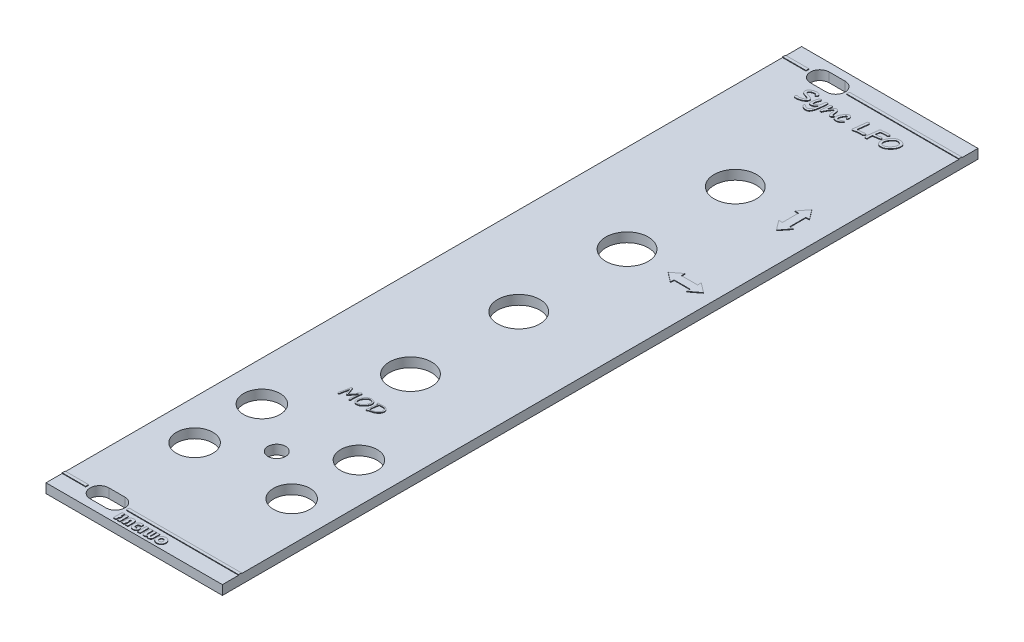
from build123d import *

# Parameters (mm, degrees)
SKIZZE2_W                       = 30
SKIZZE2_H                       = 128.5
AUFSATZ_LINEAR_AUSTRAGEN1_DEPTH = 0.8
SKIZZE3_W                       = 4
SKIZZE3_H                       = 0.5
SKIZZE3_W_2                     = 19.1
SKIZZE3_W_3                     = 0.4375
SKIZZE3_H_2                     = 1.5
AUFSATZ_LINEAR_AUSTRAGEN2_DEPTH = 0.1
SKIZZE4_R                       = 3.6
SKIZZE4_R_2                     = 3.1
SKIZZE4_R_3                     = 1.5
SCHNITT_LINEAR_AUSTRAGEN1_DEPTH = 66.99714021
AUFSATZ_LINEAR_AUSTRAGEN3_DEPTH = 0.1


with BuildPart() as part:
    # Skizze2 → Aufsatz-Linear austragen1 (new, symmetric)
    with BuildSketch(Plane(origin=(0, 0, 0), x_dir=(1, 0, 0), z_dir=(0, 1, 0))):
        Rectangle(SKIZZE2_W, SKIZZE2_H)
        with BuildLine():
            Line((-8.9, 62.85), (-6.2, 62.85))
            ThreePointArc((-6.2, 62.85), (-4.6, 61.25), (-6.2, 59.65))
            Line((-6.2, 59.65), (-8.9, 59.65))
            ThreePointArc((-8.9, 59.65), (-10.5, 61.25), (-8.9, 62.85))
        make_face(mode=Mode.SUBTRACT)
        with BuildLine():
            Line((-8.9, -59.65), (-6.2, -59.65))
            ThreePointArc((-6.2, -59.65), (-4.6, -61.25), (-6.2, -62.85))
            Line((-6.2, -62.85), (-8.9, -62.85))
            ThreePointArc((-8.9, -62.85), (-10.5, -61.25), (-8.9, -59.65))
        make_face(mode=Mode.SUBTRACT)
    extrude(amount=AUFSATZ_LINEAR_AUSTRAGEN1_DEPTH, both=True)

    # Skizze3 → Aufsatz-Linear austragen2 (add)
    # profile 1 of 18: a face of its own
    with BuildSketch(Plane(origin=(0, 0.8, 0), x_dir=(1, 0, 0), z_dir=(0, 1, 0))):
        with Locations((-13, 61.25)):
            Rectangle(SKIZZE3_W, SKIZZE3_H)
    # profile 2 of 18: a face of its own
    with BuildSketch(Plane(origin=(0, 0.8, 0), x_dir=(1, 0, 0), z_dir=(0, 1, 0))):
        with Locations((5.45, 61.25)):
            Rectangle(SKIZZE3_W_2, SKIZZE3_H)
    # profile 3 of 18: a face of its own
    with BuildSketch(Plane(origin=(0, 0.8, 0), x_dir=(1, 0, 0), z_dir=(0, 1, 0))):
        with Locations((-13, -61.25)):
            Rectangle(SKIZZE3_W, SKIZZE3_H)
    # profile 4 of 18: a face of its own
    with BuildSketch(Plane(origin=(0, 0.8, 0), x_dir=(1, 0, 0), z_dir=(0, 1, 0))):
        with Locations((5.45, -61.25)):
            Rectangle(SKIZZE3_W_2, SKIZZE3_H)
    # profile 5 of 18: a face of its own
    with BuildSketch(Plane(origin=(0, 0.8, 0), x_dir=(1, 0, 0), z_dir=(0, 1, 0))):
        with BuildLine():
            add(Edge.make_bspline(
                [(-6.554487179, 58.076923077), (-6.554792276, 58.089954635), (-6.555380523, 58.115080409), (-6.559371742, 58.151100402), (-6.565808299, 58.184181785), (-6.575068487, 58.214240665), (-6.587831737, 58.241030518), (-6.602709521, 58.264812984), (-6.62073276, 58.285307499), (-6.648611047, 58.309037053), (-6.691446947, 58.332197608), (-6.750817444, 58.352285228), (-6.820517996, 58.363278599), (-6.87012241, 58.364652876), (-6.896534455, 58.365384615)],
                knots=[0, 0, 0, 0, 0.906402374, 1.747608368, 2.517333154, 3.24814885, 3.928613535, 4.576077804, 5.193261821, 5.819231433, 7.114055839, 8.549859266, 10.162960399, 12, 12, 12, 12], degree=3))
            add(Edge.make_bspline(
                [(-6.896534455, 58.365384615), (-6.920253958, 58.365038264), (-6.967450178, 58.364349106), (-7.037550688, 58.357630565), (-7.106485966, 58.34665715), (-7.174002732, 58.33099661), (-7.240347223, 58.311595223), (-7.305218052, 58.287355602), (-7.368717945, 58.258785319), (-7.429928384, 58.22668327), (-7.486993351, 58.192396182), (-7.537071679, 58.155980418), (-7.579533328, 58.118795538), (-7.61484161, 58.081092478), (-7.642179408, 58.042015312), (-7.661620784, 58.001795206), (-7.673855124, 57.960612897), (-7.675475711, 57.93260534), (-7.676282051, 57.918669872)],
                knots=[0, 0, 0, 0, 1.173513515, 2.335015257, 3.481258319, 4.625505193, 5.762542775, 6.899580358, 8.049538388, 9.20609429, 10.318252372, 11.341037553, 12.265816017, 13.107698889, 13.891396945, 14.615581821, 15.3111675, 16, 16, 16, 16], degree=3))
            add(Edge.make_bspline(
                [(-7.676282051, 57.918669872), (-7.675351809, 57.901470904), (-7.673503557, 57.867299146), (-7.65454089, 57.818847934), (-7.625895656, 57.77399851), (-7.591703805, 57.740649349), (-7.555753348, 57.71543561), (-7.519152003, 57.694929109), (-7.473609523, 57.673839009), (-7.419089516, 57.651266311), (-7.355759185, 57.627476218), (-7.283323502, 57.602314509), (-7.201843133, 57.57662452), (-7.144448048, 57.559204951), (-7.114383013, 57.550080128)],
                knots=[0, 0, 0, 0, 0.857806506, 1.704332341, 2.569442913, 3.509531975, 4.073290341, 4.766075466, 5.607631439, 6.585913625, 7.721123853, 8.995679988, 10.426259167, 12, 12, 12, 12], degree=3))
            add(Edge.make_bspline(
                [(-7.114383013, 57.550080128), (-7.082288039, 57.540372952), (-7.019875563, 57.521496199), (-6.929720693, 57.491666192), (-6.846138125, 57.460515717), (-6.768769217, 57.429228975), (-6.698203121, 57.396573653), (-6.633766535, 57.363786405), (-6.576114617, 57.329509271), (-6.52422241, 57.295254829), (-6.478561368, 57.259357675), (-6.438830671, 57.222078783), (-6.405422995, 57.18246917), (-6.377419958, 57.141472519), (-6.356356994, 57.097998276), (-6.341202718, 57.053088665), (-6.331784624, 57.006434282), (-6.330685059, 56.974703349), (-6.330128205, 56.958633814)],
                knots=[0, 0, 0, 0, 1.533278363, 2.981641283, 4.341462187, 5.611592881, 6.796784914, 7.8961211, 8.915963566, 9.862338178, 10.737403261, 11.568934021, 12.348901324, 13.10261463, 13.8332049, 14.55014861, 15.265749993, 16, 16, 16, 16], degree=3))
            add(Edge.make_bspline(
                [(-6.330128205, 56.958633814), (-6.330551713, 56.945094435), (-6.331396921, 56.918073442), (-6.33707231, 56.87764472), (-6.346476184, 56.837689946), (-6.360278053, 56.798179912), (-6.377926126, 56.759269099), (-6.39879434, 56.720508316), (-6.424358557, 56.682906932), (-6.452950635, 56.645161105), (-6.48533763, 56.60761974), (-6.522383706, 56.571076369), (-6.562638949, 56.534583666), (-6.607188535, 56.49896429), (-6.655109215, 56.463515053), (-6.706851974, 56.428355611), (-6.762512918, 56.393817206), (-6.841564328, 56.348894017), (-6.943288528, 56.296108935), (-7.068098583, 56.241014963), (-7.194008843, 56.194265848), (-7.321108755, 56.156035471), (-7.449583776, 56.126321382), (-7.579447307, 56.105636483), (-7.71036928, 56.091765731), (-7.798108419, 56.090418346), (-7.842047276, 56.08974359)],
                knots=[0, 0, 0, 0, 0.5187735, 1.035333725, 1.561313845, 2.089312793, 2.636193803, 3.197256931, 3.773858138, 4.376450433, 5.011316299, 5.671708173, 6.369225161, 7.092518106, 7.856315086, 8.652943441, 9.488995308, 10.365732564, 12.136680431, 13.87798964, 15.590258505, 17.28009585, 18.960608946, 20.639026699, 22.316859238, 24, 24, 24, 24], degree=3))
            add(Edge.make_bspline(
                [(-7.842047276, 56.08974359), (-7.869314378, 56.090534311), (-7.921381125, 56.092044198), (-7.995427587, 56.105422601), (-8.060879167, 56.128518067), (-8.117251757, 56.159886172), (-8.163163641, 56.197874866), (-8.196352003, 56.241566786), (-8.217632519, 56.289761469), (-8.219972493, 56.323907136), (-8.221153846, 56.341145833)],
                knots=[0, 0, 0, 0, 1.297603202, 2.477783481, 3.566400177, 4.587824728, 5.535348993, 6.381086706, 7.182679451, 8, 8, 8, 8], degree=3))
            add(Edge.make_bspline(
                [(-8.221153846, 56.341145833), (-8.22055929, 56.35504601), (-8.219387383, 56.382444113), (-8.210503534, 56.422804056), (-8.195871254, 56.46161342), (-8.175848899, 56.49775702), (-8.151983821, 56.529201796), (-8.124791637, 56.553212789), (-8.094084742, 56.567871064), (-8.072558103, 56.56963794), (-8.061899038, 56.570512821)],
                knots=[0, 0, 0, 0, 1.09104836, 2.150523334, 3.229292305, 4.338466151, 5.384880842, 6.314926839, 7.165624346, 8, 8, 8, 8], degree=3))
            add(Edge.make_bspline(
                [(-8.061899038, 56.570512821), (-8.048906404, 56.570037273), (-8.023583523, 56.569110423), (-7.999841664, 56.560286257), (-7.98828125, 56.555989583)],
                knots=[0, 0, 0, 0, 1.02615765, 2, 2, 2, 2], degree=3))
            add(Edge.make_bspline(
                [(-7.98828125, 56.555989583), (-7.95962107, 56.543548671), (-7.904199429, 56.519491049), (-7.820072997, 56.49412276), (-7.739051745, 56.477322432), (-7.685706741, 56.475328821), (-7.659755609, 56.474358974)],
                knots=[0, 0, 0, 0, 1.098568057, 2.124356644, 3.08754215, 4, 4, 4, 4], degree=3))
            add(Edge.make_bspline(
                [(-7.659755609, 56.474358974), (-7.637534417, 56.474880971), (-7.592486852, 56.475939181), (-7.523945288, 56.483453811), (-7.453446397, 56.49463709), (-7.381131631, 56.511882823), (-7.306405401, 56.531740344), (-7.230312131, 56.558680647), (-7.151624815, 56.588196499), (-7.073239047, 56.622829938), (-6.99868368, 56.659034113), (-6.932086878, 56.695995067), (-6.875832119, 56.732797801), (-6.829566696, 56.769346833), (-6.793196661, 56.805912032), (-6.767219214, 56.842693336), (-6.749817903, 56.87956255), (-6.747776886, 56.904884106), (-6.746794872, 56.917067308)],
                knots=[0, 0, 0, 0, 0.998407811, 2.024006686, 3.095701557, 4.203923579, 5.363194645, 6.568305019, 7.829119502, 9.13920479, 10.417417365, 11.552604318, 12.559598689, 13.434741063, 14.198645492, 14.866660536, 15.454705579, 16, 16, 16, 16], degree=3))
            add(Edge.make_bspline(
                [(-6.746794872, 56.917067308), (-6.747796313, 56.927112164), (-6.749898321, 56.948196146), (-6.767483464, 56.977955741), (-6.79376575, 57.00683731), (-6.823610453, 57.029163182), (-6.853176013, 57.048016261), (-6.882037334, 57.062773876), (-6.915996089, 57.078676261), (-6.955231932, 57.095735488), (-6.999612758, 57.113701763), (-7.049464321, 57.132154252), (-7.104549601, 57.151712767), (-7.143241342, 57.164691637), (-7.163461538, 57.171474359)],
                knots=[0, 0, 0, 0, 0.705055393, 1.479899142, 2.381053134, 3.45574198, 4.096430202, 4.855344606, 5.740803536, 6.743317339, 7.874456067, 9.119680589, 10.494753019, 12, 12, 12, 12], degree=3))
            add(Edge.make_bspline(
                [(-7.163461538, 57.171474359), (-7.193211082, 57.181219424), (-7.250804879, 57.200085438), (-7.33380982, 57.229161677), (-7.411696047, 57.25498575), (-7.483201915, 57.281774152), (-7.549824184, 57.305191989), (-7.610432698, 57.328497473), (-7.665393749, 57.349932122), (-7.730122956, 57.375835326), (-7.802140365, 57.410680354), (-7.87896405, 57.45877243), (-7.944033836, 57.513742815), (-7.998674706, 57.57429173), (-8.04176987, 57.641736607), (-8.070971385, 57.716501906), (-8.089840342, 57.797213028), (-8.091893428, 57.853288492), (-8.092948718, 57.882111378)],
                knots=[0, 0, 0, 0, 1.187231806, 2.298428188, 3.335533646, 4.298883082, 5.194081272, 6.01363673, 6.761378685, 7.431520568, 8.657552091, 9.790397189, 10.859624885, 11.877517786, 12.87343661, 13.876274057, 14.908401178, 16, 16, 16, 16], degree=3))
            add(Edge.make_bspline(
                [(-8.092948718, 57.882111378), (-8.091706528, 57.908571416), (-8.089220343, 57.961529929), (-8.071621792, 58.040119181), (-8.041926783, 58.116903551), (-8.001113145, 58.192354702), (-7.948107094, 58.265879465), (-7.883977785, 58.338105379), (-7.808633067, 58.409219925), (-7.722759626, 58.477402775), (-7.62920272, 58.540731165), (-7.530494265, 58.597193538), (-7.427185276, 58.644428584), (-7.319916394, 58.682917172), (-7.20872378, 58.713076961), (-7.09354691, 58.734713599), (-6.974268359, 58.747197413), (-6.893391267, 58.749058307), (-6.852463942, 58.75)],
                knots=[0, 0, 0, 0, 0.767401818, 1.535918413, 2.323829708, 3.149434188, 4.017565943, 4.947439468, 5.94777927, 7.019533282, 8.12502747, 9.222515199, 10.314732901, 11.416188546, 12.525241406, 13.65367676, 14.812658419, 16, 16, 16, 16], degree=3))
            add(Edge.make_bspline(
                [(-6.852463942, 58.75), (-6.829253491, 58.74953772), (-6.783947448, 58.748635365), (-6.717673643, 58.743872061), (-6.655125288, 58.734816167), (-6.59634991, 58.722425163), (-6.541580897, 58.70641134), (-6.490492409, 58.68696126), (-6.443462644, 58.66318774), (-6.399950352, 58.636914991), (-6.361142699, 58.608102987), (-6.327534953, 58.577863717), (-6.298317945, 58.547407423), (-6.27523854, 58.515030055), (-6.256884303, 58.481794897), (-6.243817356, 58.447419953), (-6.235264799, 58.412042562), (-6.234405238, 58.387968999), (-6.233974359, 58.375901442)],
                knots=[0, 0, 0, 0, 1.40143273, 2.735550995, 4.008304895, 5.214057515, 6.35892893, 7.450064129, 8.509221683, 9.535900356, 10.515497815, 11.421908727, 12.263292432, 13.057608652, 13.815276371, 14.548971511, 15.272630835, 16, 16, 16, 16], degree=3))
            add(Edge.make_bspline(
                [(-6.233974359, 58.375901442), (-6.234798492, 58.352436583), (-6.236354612, 58.308130447), (-6.251528685, 58.246124886), (-6.276570363, 58.193095123), (-6.31267294, 58.149565966), (-6.359417774, 58.116391679), (-6.415806337, 58.092882133), (-6.48204021, 58.078973213), (-6.529375142, 58.077633708), (-6.554487179, 58.076923077)],
                knots=[0, 0, 0, 0, 1.119776942, 2.114352742, 3.027799396, 3.900150592, 4.785861252, 5.740201081, 6.801135797, 8, 8, 8, 8], degree=3))
        make_face()
    # profile 6 of 18: a face of its own
    with BuildSketch(Plane(origin=(0, 0.8, 0), x_dir=(1, 0, 0), z_dir=(0, 1, 0))):
        with BuildLine():
            add(Edge.make_bspline(
                [(-4.278846154, 57.242588141), (-4.283996789, 57.174281292), (-4.294234775, 57.03850686), (-4.315815395, 56.836747289), (-4.342986953, 56.638034002), (-4.374956661, 56.443293871), (-4.413480591, 56.254245877), (-4.460199814, 56.073346796), (-4.516062929, 55.901552372), (-4.568958419, 55.765470099), (-4.614550368, 55.663263791), (-4.649855016, 55.593885966), (-4.684290022, 55.529977529), (-4.720860749, 55.473055334), (-4.757359813, 55.422008808), (-4.795241146, 55.377631206), (-4.833279145, 55.339281564), (-4.87229817, 55.306661466), (-4.912770664, 55.279488364), (-4.954924172, 55.256254304), (-4.998678675, 55.236174241), (-5.044528527, 55.220243261), (-5.092044787, 55.207563364), (-5.141435453, 55.198553353), (-5.192878004, 55.19368032), (-5.227688224, 55.19277045), (-5.245392628, 55.192307692)],
                knots=[0, 0, 0, 0, 2.00175863, 3.978922287, 5.928656077, 7.862296602, 9.745190496, 11.565024947, 13.319121211, 15.02136192, 15.829252738, 16.588486283, 17.295924739, 17.949578658, 18.564337243, 19.128401805, 19.652735712, 20.141187321, 20.61204981, 21.074986084, 21.546555649, 22.017140067, 22.491652805, 22.982534536, 23.48251923, 24, 24, 24, 24], degree=3))
            add(Edge.make_bspline(
                [(-5.245392628, 55.192307692), (-5.283681756, 55.193370705), (-5.359595355, 55.195478276), (-5.47225844, 55.212299364), (-5.582764606, 55.238577155), (-5.653627192, 55.265478772), (-5.689102564, 55.278946314)],
                knots=[0, 0, 0, 0, 1.009780963, 2.002033224, 2.999773803, 4, 4, 4, 4], degree=3))
            Line((-5.689102564, 55.278946314), (-5.693609776, 55.278946314))
            add(Edge.make_bspline(
                [(-5.693609776, 55.278946314), (-5.722746209, 55.291950624), (-5.780242179, 55.317612495), (-5.861290164, 55.364766522), (-5.936705998, 55.417843696), (-5.994233932, 55.467312137), (-6.035434877, 55.508722169), (-6.062677961, 55.538019835), (-6.085375245, 55.56646446), (-6.104659369, 55.593214715), (-6.119392928, 55.619236626), (-6.12938621, 55.64423366), (-6.136642092, 55.667662226), (-6.137440835, 55.683212997), (-6.137820513, 55.690604968)],
                knots=[0, 0, 0, 0, 1.828278267, 3.607807206, 5.365739559, 7.109782234, 7.94897562, 8.714472704, 9.402051214, 10.034024339, 10.603878186, 11.110416056, 11.577141299, 12, 12, 12, 12], degree=3))
            add(Edge.make_bspline(
                [(-6.137820513, 55.690604968), (-6.137425667, 55.703345765), (-6.136674887, 55.7275718), (-6.128689821, 55.7617634), (-6.117214867, 55.7925), (-6.099083569, 55.818113436), (-6.077954092, 55.839565848), (-6.052439007, 55.8542858), (-6.024309607, 55.863854643), (-6.00435468, 55.864864949), (-5.994090545, 55.865384615)],
                knots=[0, 0, 0, 0, 1.20059287, 2.282871583, 3.301520604, 4.276547981, 5.224045995, 6.121579836, 7.033804691, 8, 8, 8, 8], degree=3))
            add(Edge.make_bspline(
                [(-5.994090545, 55.865384615), (-5.9851726, 55.864787687), (-5.967583044, 55.863610319), (-5.942416923, 55.854754594), (-5.91961012, 55.839859453), (-5.907640232, 55.825991056), (-5.901442308, 55.818810096)],
                knots=[0, 0, 0, 0, 0.994717393, 1.961958436, 2.944716275, 4, 4, 4, 4], degree=3))
            add(Edge.make_bspline(
                [(-5.901442308, 55.818810096), (-5.882432127, 55.796935156), (-5.84476622, 55.753593145), (-5.779254056, 55.697707846), (-5.70773387, 55.650386255), (-5.629887233, 55.611500225), (-5.545764061, 55.581570992), (-5.455478154, 55.559937426), (-5.358916323, 55.547575647), (-5.292503039, 55.545788915), (-5.258413462, 55.544871795)],
                knots=[0, 0, 0, 0, 0.959799894, 1.901703793, 2.844225409, 3.797170874, 4.779307156, 5.798199044, 6.869827527, 8, 8, 8, 8], degree=3))
            add(Edge.make_bspline(
                [(-5.258413462, 55.544871795), (-5.244065818, 55.545968824), (-5.214610395, 55.548221003), (-5.171490498, 55.566438996), (-5.1290802, 55.594560803), (-5.087432117, 55.63402925), (-5.046461781, 55.684207817), (-5.006039691, 55.745263476), (-4.966240962, 55.817335886), (-4.926862188, 55.898944639), (-4.888988382, 55.988211663), (-4.855331227, 56.083371362), (-4.824639683, 56.182753784), (-4.797719332, 56.286551093), (-4.774106427, 56.394604264), (-4.754780606, 56.507267192), (-4.738503695, 56.624154172), (-4.731246007, 56.70385683), (-4.727564103, 56.744290865)],
                knots=[0, 0, 0, 0, 0.497393467, 1.021138791, 1.603813841, 2.260843158, 3.006854359, 3.851866658, 4.802775032, 5.866932167, 7.000819296, 8.171935065, 9.374281906, 10.615766538, 11.898609708, 13.218103299, 14.588713216, 16, 16, 16, 16], degree=3))
            add(Edge.make_bspline(
                [(-4.727564103, 56.744290865), (-4.749173627, 56.726812697), (-4.791526238, 56.69255715), (-4.855293938, 56.644219908), (-4.916690248, 56.598521458), (-4.976307208, 56.556447492), (-5.033877492, 56.517810874), (-5.089686068, 56.482626098), (-5.143441915, 56.450691323), (-5.195392096, 56.421998616), (-5.245189941, 56.39608674), (-5.293849797, 56.375025005), (-5.340017774, 56.355915867), (-5.384500116, 56.341246055), (-5.426797035, 56.328751862), (-5.46748302, 56.32026491), (-5.506334709, 56.314966481), (-5.531668809, 56.314383391), (-5.543870192, 56.314102564)],
                knots=[0, 0, 0, 0, 1.423599046, 2.79011861, 4.09846614, 5.344025416, 6.527481519, 7.64963328, 8.723129498, 9.729766038, 10.689663664, 11.5969681, 12.444908703, 13.248030334, 13.995066441, 14.702796591, 15.375242186, 16, 16, 16, 16], degree=3))
            add(Edge.make_bspline(
                [(-5.543870192, 56.314102564), (-5.558924258, 56.314591162), (-5.588365426, 56.31554671), (-5.631360073, 56.32282628), (-5.671950568, 56.334128154), (-5.710188249, 56.350423177), (-5.745823196, 56.371556503), (-5.779072887, 56.39750411), (-5.810329447, 56.427434444), (-5.838037949, 56.462379081), (-5.863606011, 56.499835869), (-5.884687229, 56.540413509), (-5.904374989, 56.581789507), (-5.918951548, 56.625820424), (-5.931481082, 56.671344714), (-5.938748822, 56.71909907), (-5.945030922, 56.768333422), (-5.945350368, 56.801860352), (-5.945512821, 56.818910256)],
                knots=[0, 0, 0, 0, 1.00165068, 1.958923706, 2.894604517, 3.800718374, 4.717400304, 5.644263435, 6.603018757, 7.590515506, 8.607580867, 9.61684597, 10.631236758, 11.653871804, 12.699670095, 13.770207859, 14.866053566, 16, 16, 16, 16], degree=3))
            add(Edge.make_bspline(
                [(-5.945512821, 56.818910256), (-5.945190536, 56.83728067), (-5.944509971, 56.876073315), (-5.939673723, 56.93704762), (-5.932132452, 57.003854614), (-5.92129828, 57.076424284), (-5.908599156, 57.155185672), (-5.891551786, 57.239678025), (-5.87294142, 57.330329286), (-5.850632636, 57.424027662), (-5.827670123, 57.51594507), (-5.805961977, 57.601266005), (-5.784448227, 57.677091035), (-5.763506985, 57.743316646), (-5.743971726, 57.800319196), (-5.725863503, 57.848045309), (-5.707983874, 57.886233416), (-5.690593827, 57.916417607), (-5.671635738, 57.939977481), (-5.651112302, 57.959789123), (-5.627431152, 57.975988849), (-5.601516993, 57.989394924), (-5.572972332, 58.000133215), (-5.541836465, 58.007440544), (-5.508116262, 58.012037069), (-5.48479135, 58.012553863), (-5.47275641, 58.012820513)],
                knots=[0, 0, 0, 0, 0.957882983, 2.022753196, 3.187830127, 4.463193325, 5.848458912, 7.347352035, 8.957267661, 10.67387793, 12.369190335, 13.897767392, 15.264447206, 16.478539246, 17.51911675, 18.406578563, 19.138609515, 19.716347969, 20.217988658, 20.71055982, 21.198338869, 21.708368279, 22.228984612, 22.784251995, 23.372711278, 24, 24, 24, 24], degree=3))
            add(Edge.make_bspline(
                [(-5.47275641, 58.012820513), (-5.459958273, 58.011973039), (-5.435141801, 58.010329729), (-5.400048524, 57.996879357), (-5.370727534, 57.973133244), (-5.347475303, 57.9416946), (-5.328041683, 57.906301603), (-5.314755934, 57.867618094), (-5.305579096, 57.82728725), (-5.30485459, 57.799531952), (-5.304487179, 57.785456731)],
                knots=[0, 0, 0, 0, 0.975068157, 1.890724535, 2.815992283, 3.81498953, 4.858259611, 5.885852315, 6.927876886, 8, 8, 8, 8], degree=3))
            add(Edge.make_bspline(
                [(-5.304487179, 57.785456731), (-5.30511173, 57.782108232), (-5.306850906, 57.772783721), (-5.31216191, 57.755177163), (-5.321359929, 57.730415663), (-5.333991493, 57.697997713), (-5.350602581, 57.658437401), (-5.369989582, 57.610993583), (-5.393741084, 57.556565626), (-5.410660536, 57.517696211), (-5.419671474, 57.496995192)],
                knots=[0, 0, 0, 0, 0.262791583, 0.731791455, 1.416486415, 2.301768724, 3.41677343, 4.728012174, 6.257409342, 8, 8, 8, 8], degree=3))
            add(Edge.make_bspline(
                [(-5.419671474, 57.496995192), (-5.430913204, 57.470709243), (-5.452812701, 57.419502796), (-5.481093632, 57.343164263), (-5.506223604, 57.270103594), (-5.525473671, 57.199223639), (-5.541350285, 57.131301408), (-5.552126229, 57.066042677), (-5.559932354, 57.003727708), (-5.560580813, 56.962996715), (-5.560897436, 56.943108974)],
                knots=[0, 0, 0, 0, 1.192149486, 2.322371505, 3.394578435, 4.41311333, 5.384264131, 6.302223776, 7.171026013, 8, 8, 8, 8], degree=3))
            add(Edge.make_bspline(
                [(-5.560897436, 56.943108974), (-5.560637446, 56.924384067), (-5.560148119, 56.889141868), (-5.553351564, 56.839896864), (-5.544013322, 56.797240184), (-5.529705017, 56.762091691), (-5.51245678, 56.73505235), (-5.495801679, 56.714714051), (-5.477575377, 56.701517242), (-5.464401652, 56.69961068), (-5.458233173, 56.698717949)],
                knots=[0, 0, 0, 0, 1.580255723, 2.974203494, 4.191749841, 5.260131258, 6.159911468, 6.889464284, 7.480001601, 8, 8, 8, 8], degree=3))
            add(Edge.make_bspline(
                [(-5.458233173, 56.698717949), (-5.443840742, 56.699375731), (-5.413306067, 56.700771268), (-5.365431183, 56.710392253), (-5.313588611, 56.726360543), (-5.256642449, 56.747360457), (-5.195216515, 56.776965871), (-5.128957177, 56.815201095), (-5.057332708, 56.862111009), (-4.996521944, 56.907638093), (-4.946762448, 56.94499562), (-4.912858924, 56.972984893), (-4.881562808, 56.998018728), (-4.854693767, 57.022484706), (-4.830512258, 57.0440325), (-4.810545809, 57.064480974), (-4.793136399, 57.082078395), (-4.775608695, 57.104805468), (-4.756492133, 57.133775321), (-4.737022188, 57.172130227), (-4.720145669, 57.21492404), (-4.707678157, 57.254535459), (-4.699357985, 57.29186701), (-4.692817918, 57.327586894), (-4.686955309, 57.370875094), (-4.681590399, 57.421486837), (-4.676706609, 57.479611836), (-4.671602944, 57.545034476), (-4.667177524, 57.617997606), (-4.664737154, 57.66910089), (-4.663461538, 57.695813301)],
                knots=[0, 0, 0, 0, 0.851049212, 1.805567829, 2.876887701, 4.057728334, 5.391278813, 6.903488802, 8.579188005, 10.45103088, 11.394819902, 12.258204215, 13.050729787, 13.763972059, 14.406785208, 14.965225586, 15.454060319, 15.868798653, 16.660093594, 17.503377858, 18.407130841, 19.378249266, 19.955398139, 20.667956902, 21.52516743, 22.537942204, 23.677497575, 24.974482115, 26.418518934, 28, 28, 28, 28], degree=3))
            add(Edge.make_bspline(
                [(-4.663461538, 57.695813301), (-4.66288018, 57.711342664), (-4.661773281, 57.740910397), (-4.658859833, 57.782937981), (-4.657265376, 57.820542574), (-4.654612388, 57.85358162), (-4.652113245, 57.881956024), (-4.649893488, 57.905900126), (-4.646568282, 57.925170587), (-4.643768766, 57.945434179), (-4.636412293, 57.967259206), (-4.623944432, 57.991712335), (-4.605764025, 58.014269002), (-4.584004942, 58.035808195), (-4.557545164, 58.054771336), (-4.525767779, 58.067468258), (-4.490117511, 58.075856431), (-4.464864228, 58.076556168), (-4.451622596, 58.076923077)],
                knots=[0, 0, 0, 0, 1.488084273, 2.833295677, 4.033959135, 5.092066823, 6.006775041, 6.76236265, 7.393156644, 7.879355698, 8.718589273, 9.583762216, 10.495111641, 11.478615764, 12.511918219, 13.586680609, 14.73456909, 16, 16, 16, 16], degree=3))
            add(Edge.make_bspline(
                [(-4.451622596, 58.076923077), (-4.434384482, 58.076431777), (-4.40213916, 58.07551276), (-4.357876799, 58.066773135), (-4.321170767, 58.052332146), (-4.296448054, 58.034168194), (-4.281368253, 58.014938051), (-4.271982128, 57.99653799), (-4.264174425, 57.97444151), (-4.257572518, 57.948304666), (-4.252844203, 57.918121342), (-4.249558346, 57.883831969), (-4.246746331, 57.845764187), (-4.246778172, 57.819016555), (-4.246794872, 57.804987981)],
                knots=[0, 0, 0, 0, 1.539771471, 2.880270119, 4.011047751, 5.043823079, 5.575249402, 6.182747175, 6.881468037, 7.666926675, 8.589438527, 9.609629148, 10.746300379, 12, 12, 12, 12], degree=3))
            Line((-4.246794872, 57.804987981), (-4.278846154, 57.242588141))
        make_face()
    # profile 7 of 18: a face of its own
    with BuildSketch(Plane(origin=(0, 0.8, 0), x_dir=(1, 0, 0), z_dir=(0, 1, 0))):
        with BuildLine():
            add(Edge.make_bspline(
                [(-2.498497596, 56.491386218), (-2.505094283, 56.505974986), (-2.519242704, 56.537264636), (-2.536433191, 56.590008415), (-2.552119662, 56.651147857), (-2.56715225, 56.72078812), (-2.580515258, 56.799000114), (-2.592296896, 56.88589289), (-2.603424669, 56.981208351), (-2.609186303, 57.047758666), (-2.612179487, 57.082331731)],
                knots=[0, 0, 0, 0, 0.635309353, 1.362596704, 2.198551025, 3.141039548, 4.190361142, 5.347965813, 6.622261201, 8, 8, 8, 8], degree=3))
            add(Edge.make_bspline(
                [(-2.612179487, 57.082331731), (-2.615358876, 57.117422506), (-2.621324969, 57.18327002), (-2.634480254, 57.274792226), (-2.650926413, 57.35243371), (-2.669125382, 57.416289478), (-2.690723413, 57.466631896), (-2.715471651, 57.502847535), (-2.74418972, 57.527578612), (-2.766396963, 57.530611143), (-2.776943109, 57.532051282)],
                knots=[0, 0, 0, 0, 1.669474181, 3.132752831, 4.378613114, 5.427244083, 6.277016499, 6.957496843, 7.504918713, 8, 8, 8, 8], degree=3))
            add(Edge.make_bspline(
                [(-2.776943109, 57.532051282), (-2.782326407, 57.531596972), (-2.793674934, 57.530639242), (-2.811005551, 57.524534281), (-2.829583475, 57.515371135), (-2.849769602, 57.502678496), (-2.871067587, 57.486079108), (-2.893789701, 57.465807164), (-2.91763419, 57.441684096), (-2.943147881, 57.414091843), (-2.970194671, 57.383156518), (-2.998274857, 57.348169565), (-3.028229469, 57.309948808), (-3.059248365, 57.267834137), (-3.09131951, 57.221865579), (-3.125355721, 57.17266131), (-3.160301413, 57.119383111), (-3.208180908, 57.045289366), (-3.26580957, 56.953792531), (-3.329296972, 56.84809817), (-3.386109565, 56.750382331), (-3.435895268, 56.660400936), (-3.478090031, 56.577683538), (-3.513118245, 56.502673753), (-3.541853985, 56.435568521), (-3.556426084, 56.392650353), (-3.563201122, 56.372696314)],
                knots=[0, 0, 0, 0, 0.271980462, 0.573361889, 0.920377903, 1.318197382, 1.775334971, 2.283114329, 2.855616678, 3.488204608, 4.181621449, 4.931087743, 5.754362313, 6.6348723, 7.573144249, 8.586073116, 9.657392542, 10.791975691, 13.043014552, 15.120014281, 17.020774108, 18.75331067, 20.314831487, 21.710866525, 22.935708098, 24, 24, 24, 24], degree=3))
            add(Edge.make_bspline(
                [(-3.563201122, 56.372696314), (-3.565904689, 56.361915576), (-3.57117663, 56.3408932), (-3.584043661, 56.311466017), (-3.600041913, 56.284852619), (-3.618785234, 56.261638916), (-3.638968947, 56.242573839), (-3.659827307, 56.228866875), (-3.680443217, 56.219347997), (-3.694657125, 56.218399946), (-3.701422276, 56.217948718)],
                knots=[0, 0, 0, 0, 1.20417918, 2.348142232, 3.469513409, 4.564237853, 5.576761071, 6.465938645, 7.269859125, 8, 8, 8, 8], degree=3))
            add(Edge.make_bspline(
                [(-3.701422276, 56.217948718), (-3.721504068, 56.218713001), (-3.759335826, 56.220152822), (-3.812570693, 56.230886627), (-3.85780671, 56.249860055), (-3.895518214, 56.276467459), (-3.924220946, 56.311717411), (-3.944259583, 56.354356491), (-3.956464833, 56.404248644), (-3.957685018, 56.439894544), (-3.958333333, 56.458834135)],
                knots=[0, 0, 0, 0, 1.194318992, 2.249957814, 3.210972496, 4.092954214, 4.967750625, 5.88271545, 6.875031845, 8, 8, 8, 8], degree=3))
            add(Edge.make_bspline(
                [(-3.958333333, 56.458834135), (-3.958059314, 56.46668324), (-3.957434588, 56.48457812), (-3.954793759, 56.514825906), (-3.950139164, 56.551524964), (-3.944062979, 56.594754752), (-3.936624481, 56.644376593), (-3.927034448, 56.700462237), (-3.915382158, 56.763009527), (-3.907094623, 56.806892934), (-3.902744391, 56.829927885)],
                knots=[0, 0, 0, 0, 0.501863737, 1.144180291, 1.939451587, 2.865813695, 3.934029402, 5.145949852, 6.50187323, 8, 8, 8, 8], degree=3))
            add(Edge.make_bspline(
                [(-3.902744391, 56.829927885), (-3.896833603, 56.861940422), (-3.884706653, 56.927619386), (-3.8706378, 57.029259804), (-3.8580935, 57.135950625), (-3.847506693, 57.247809404), (-3.83956169, 57.364872515), (-3.834285359, 57.487275456), (-3.830530639, 57.614827017), (-3.830264043, 57.701653084), (-3.830128205, 57.745893429)],
                knots=[0, 0, 0, 0, 0.848972436, 1.741806054, 2.6755722, 3.650807885, 4.672020689, 5.735473538, 6.846159507, 8, 8, 8, 8], degree=3))
            add(Edge.make_bspline(
                [(-3.830128205, 57.745893429), (-3.829103308, 57.759656787), (-3.826965704, 57.788362691), (-3.813832307, 57.831878307), (-3.791513697, 57.876207263), (-3.762598573, 57.920064829), (-3.729064848, 57.959506132), (-3.693175379, 57.990257509), (-3.654610982, 58.00887677), (-3.628142866, 58.011531046), (-3.615284455, 58.012820513)],
                knots=[0, 0, 0, 0, 0.894812457, 1.866288767, 2.928706177, 4.111051818, 5.272311139, 6.282034119, 7.165399174, 8, 8, 8, 8], degree=3))
            add(Edge.make_bspline(
                [(-3.615284455, 58.012820513), (-3.599869589, 58.012372088), (-3.570706842, 58.011523731), (-3.529773457, 58.001791814), (-3.494441187, 57.986161704), (-3.46865771, 57.967714391), (-3.452382583, 57.947027589), (-3.44124334, 57.926911238), (-3.433315221, 57.901081626), (-3.425555038, 57.870746147), (-3.420690967, 57.834943088), (-3.415665756, 57.794434388), (-3.414326055, 57.748568339), (-3.413760385, 57.716343465), (-3.413461538, 57.69931891)],
                knots=[0, 0, 0, 0, 1.273100463, 2.40852606, 3.453071025, 4.458360528, 4.988873969, 5.619253453, 6.348505187, 7.215929825, 8.208045276, 9.333434231, 10.591240509, 12, 12, 12, 12], degree=3))
            add(Edge.make_bspline(
                [(-3.413461538, 57.69931891), (-3.41380947, 57.684120142), (-3.414579155, 57.650497853), (-3.419536481, 57.595384927), (-3.427109042, 57.530771114), (-3.437720241, 57.456642899), (-3.451500357, 57.373071361), (-3.467261, 57.279808767), (-3.487053052, 57.17721214), (-3.501542005, 57.105689988), (-3.509114583, 57.068309295)],
                knots=[0, 0, 0, 0, 0.570922533, 1.262978776, 2.077319149, 3.014643928, 4.075409849, 5.258851571, 6.567352553, 8, 8, 8, 8], degree=3))
            add(Edge.make_bspline(
                [(-3.509114583, 57.068309295), (-3.494358896, 57.103983347), (-3.465613043, 57.173480693), (-3.419225933, 57.272907943), (-3.373309048, 57.366020463), (-3.326432113, 57.452212951), (-3.278254787, 57.531173787), (-3.2302487, 57.603847011), (-3.18123438, 57.669369317), (-3.131755695, 57.728422953), (-3.081111302, 57.779876949), (-3.030476934, 57.825117262), (-2.978555519, 57.862878268), (-2.926134766, 57.894067223), (-2.872922873, 57.918445015), (-2.819136258, 57.936385632), (-2.764301222, 57.946477529), (-2.72756827, 57.94797476), (-2.709334936, 57.948717949)],
                knots=[0, 0, 0, 0, 1.477410927, 2.878174209, 4.198278573, 5.450637904, 6.6318729, 7.737638791, 8.782921821, 9.762167772, 10.683860829, 11.543969525, 12.358041955, 13.137138281, 13.874786096, 14.594081238, 15.302136478, 16, 16, 16, 16], degree=3))
            add(Edge.make_bspline(
                [(-2.709334936, 57.948717949), (-2.693781608, 57.94824477), (-2.663155763, 57.94731304), (-2.618541892, 57.939748584), (-2.576607496, 57.927021859), (-2.536853799, 57.90996852), (-2.499973433, 57.887300292), (-2.465249397, 57.859802056), (-2.433473048, 57.82707437), (-2.403574331, 57.789905978), (-2.377209427, 57.747223914), (-2.352606305, 57.70009853), (-2.330519289, 57.647892127), (-2.311852659, 57.590431757), (-2.294687096, 57.528323869), (-2.280420898, 57.461236076), (-2.26821419, 57.389237781), (-2.262545657, 57.339442782), (-2.259615385, 57.313701923)],
                knots=[0, 0, 0, 0, 0.867006461, 1.707210621, 2.514163583, 3.306267039, 4.112521643, 4.920869512, 5.770050741, 6.651087263, 7.575702763, 8.562522473, 9.613762229, 10.732417367, 11.929365476, 13.205677602, 14.555512423, 16, 16, 16, 16], degree=3))
            add(Edge.make_bspline(
                [(-2.259615385, 57.313701923), (-2.256814642, 57.287656079), (-2.251372785, 57.237048866), (-2.24287515, 57.163761576), (-2.234534106, 57.095435963), (-2.225405876, 57.03236617), (-2.216402922, 56.974268927), (-2.207599249, 56.92110675), (-2.198006842, 56.873058887), (-2.188491584, 56.829984325), (-2.179345778, 56.791915895), (-2.169072694, 56.759114268), (-2.159391191, 56.731240987), (-2.149405689, 56.708161671), (-2.13909596, 56.690360413), (-2.129129302, 56.67686122), (-2.117994574, 56.668574211), (-2.109965205, 56.667256603), (-2.106370192, 56.666666667)],
                knots=[0, 0, 0, 0, 1.850180121, 3.59490967, 5.210872959, 6.711536731, 8.095582651, 9.36324855, 10.517075383, 11.555494767, 12.479137362, 13.280966361, 13.982069674, 14.562675998, 15.054065416, 15.431540095, 15.745481797, 16, 16, 16, 16], degree=3))
            add(Edge.make_bspline(
                [(-2.106370192, 56.666666667), (-2.092425321, 56.667688798), (-2.062233694, 56.669901783), (-2.03329883, 56.678868649), (-2.017728365, 56.68369391)],
                knots=[0, 0, 0, 0, 0.923757532, 2, 2, 2, 2], degree=3))
            add(Edge.make_bspline(
                [(-2.017728365, 56.68369391), (-2.008434469, 56.686900273), (-1.990862468, 56.692962554), (-1.965406535, 56.698431862), (-1.943285703, 56.703254097), (-1.92944139, 56.703577355), (-1.923076923, 56.703725962)],
                knots=[0, 0, 0, 0, 1.212891995, 2.293219056, 3.215363763, 4, 4, 4, 4], degree=3))
            add(Edge.make_bspline(
                [(-1.923076923, 56.703725962), (-1.916703076, 56.703484228), (-1.904770828, 56.703031687), (-1.88790965, 56.698419885), (-1.873852328, 56.690403208), (-1.862188002, 56.67922462), (-1.853193525, 56.665176602), (-1.847342558, 56.647818673), (-1.843134763, 56.627806201), (-1.843013184, 56.613274275), (-1.842948718, 56.60556891)],
                knots=[0, 0, 0, 0, 1.054231433, 1.973588656, 2.865496172, 3.706647277, 4.627251651, 5.598398023, 6.726581707, 8, 8, 8, 8], degree=3))
            add(Edge.make_bspline(
                [(-1.842948718, 56.60556891), (-1.84430053, 56.590187766), (-1.847154637, 56.557713267), (-1.869274856, 56.509727522), (-1.904108294, 56.461535381), (-1.949168693, 56.41268661), (-2.004550252, 56.368840418), (-2.06903723, 56.336595799), (-2.14071005, 56.317765321), (-2.190725171, 56.315349685), (-2.216546474, 56.314102564)],
                knots=[0, 0, 0, 0, 0.713168231, 1.505725529, 2.413970818, 3.473447514, 4.584611672, 5.677533716, 6.80098047, 8, 8, 8, 8], degree=3))
            add(Edge.make_bspline(
                [(-2.216546474, 56.314102564), (-2.231604008, 56.314729905), (-2.260772271, 56.315945141), (-2.303064161, 56.323919029), (-2.341935004, 56.338017579), (-2.377305009, 56.35781452), (-2.409574734, 56.382791261), (-2.438118216, 56.41367981), (-2.46342161, 56.450184867), (-2.476967224, 56.477339269), (-2.483974359, 56.491386218)],
                knots=[0, 0, 0, 0, 1.058542098, 2.050524074, 3.012049976, 3.952431309, 4.889070618, 5.868829149, 6.897547158, 8, 8, 8, 8], degree=3))
            Line((-2.483974359, 56.491386218), (-2.498497596, 56.491386218))
        make_face()
    # profile 8 of 18: a face of its own
    with BuildSketch(Plane(origin=(0, 0.8, 0), x_dir=(1, 0, 0), z_dir=(0, 1, 0))):
        with BuildLine():
            add(Edge.make_bspline(
                [(-1.108273237, 56.153846154), (-1.130993123, 56.154348477), (-1.175209433, 56.155326073), (-1.23957524, 56.162276476), (-1.299723022, 56.174255532), (-1.355627404, 56.190678044), (-1.407363893, 56.211907532), (-1.455120048, 56.237798178), (-1.498395561, 56.269087477), (-1.537146597, 56.304814999), (-1.571360374, 56.344801935), (-1.601544175, 56.388275459), (-1.626715176, 56.435925093), (-1.647189646, 56.48716644), (-1.663159389, 56.542022013), (-1.674807024, 56.600473932), (-1.68105271, 56.662691409), (-1.682136712, 56.705382599), (-1.682692308, 56.727263622)],
                knots=[0, 0, 0, 0, 1.179335333, 2.295163596, 3.355644885, 4.359149753, 5.315054668, 6.253557501, 7.172288246, 8.079917339, 8.983192275, 9.899016738, 10.821662546, 11.774301688, 12.758730008, 13.783523432, 14.863962943, 16, 16, 16, 16], degree=3))
            add(Edge.make_bspline(
                [(-1.682692308, 56.727263622), (-1.68155267, 56.763041958), (-1.679235937, 56.835774592), (-1.66251319, 56.94578542), (-1.635217471, 57.057995591), (-1.596914666, 57.17213051), (-1.547778659, 57.288245605), (-1.488606306, 57.40662797), (-1.417953629, 57.526970905), (-1.338727648, 57.646675862), (-1.25467003, 57.760323594), (-1.168911388, 57.861158279), (-1.083469052, 57.946827257), (-0.998369985, 58.01705474), (-0.913371186, 58.072201606), (-0.828271489, 58.111307417), (-0.743475883, 58.13667854), (-0.686427712, 58.139598791), (-0.658553686, 58.141025641)],
                knots=[0, 0, 0, 0, 0.919250318, 1.868714514, 2.853010244, 3.884014905, 4.958803626, 6.090719227, 7.282662772, 8.542674009, 9.778172279, 10.913051174, 11.941383826, 12.883414713, 13.743804135, 14.536600162, 15.284975417, 16, 16, 16, 16], degree=3))
            add(Edge.make_bspline(
                [(-0.658553686, 58.141025641), (-0.645325673, 58.140573553), (-0.619316292, 58.139684642), (-0.581110622, 58.131717947), (-0.544464111, 58.119374093), (-0.509436082, 58.101336618), (-0.475785221, 58.078703736), (-0.443598416, 58.051042054), (-0.413494172, 58.017911573), (-0.375589844, 57.968619419), (-0.334791136, 57.902542744), (-0.298677991, 57.819334592), (-0.276530444, 57.734016259), (-0.273796521, 57.67640731), (-0.272435897, 57.647736378)],
                knots=[0, 0, 0, 0, 0.692388977, 1.361399399, 2.036330382, 2.713072656, 3.419030596, 4.157147995, 4.930891691, 5.760189733, 7.413379975, 8.984565664, 10.499272904, 12, 12, 12, 12], degree=3))
            add(Edge.make_bspline(
                [(-0.272435897, 57.647736378), (-0.272686335, 57.634716735), (-0.273165225, 57.609820431), (-0.275164561, 57.574096552), (-0.280744649, 57.541976055), (-0.286098221, 57.512579849), (-0.294831686, 57.486707759), (-0.304603629, 57.463804302), (-0.316777337, 57.444361183), (-0.334969534, 57.423914804), (-0.359078917, 57.40418969), (-0.387420981, 57.385457142), (-0.416178472, 57.374042439), (-0.435443695, 57.372524906), (-0.444711538, 57.371794872)],
                knots=[0, 0, 0, 0, 1.294637572, 2.475620114, 3.550422507, 4.533167132, 5.440912921, 6.257997015, 7.003735524, 7.709256772, 8.969082695, 10.087690457, 11.080052981, 12, 12, 12, 12], degree=3))
            add(Edge.make_bspline(
                [(-0.444711538, 57.371794872), (-0.457484161, 57.372400663), (-0.48216706, 57.373571346), (-0.51684319, 57.384498082), (-0.547671052, 57.40185866), (-0.573284778, 57.427292029), (-0.595403763, 57.45902864), (-0.611794615, 57.4982343), (-0.625126522, 57.543725133), (-0.629628124, 57.576696171), (-0.632011218, 57.594150641)],
                knots=[0, 0, 0, 0, 0.946631709, 1.829351386, 2.673952463, 3.551165196, 4.487009658, 5.531015696, 6.692949509, 8, 8, 8, 8], degree=3))
            add(Edge.make_bspline(
                [(-0.632011218, 57.594150641), (-0.633668107, 57.60686608), (-0.63678072, 57.63075316), (-0.643782481, 57.663703683), (-0.6517337, 57.691733975), (-0.660761193, 57.714929561), (-0.672110285, 57.732832683), (-0.683853295, 57.746602715), (-0.698106409, 57.754877652), (-0.708210963, 57.755907694), (-0.713141026, 57.756410256)],
                knots=[0, 0, 0, 0, 1.581918417, 2.971773901, 4.151745715, 5.176999831, 6.028607472, 6.757512058, 7.393783903, 8, 8, 8, 8], degree=3))
            add(Edge.make_bspline(
                [(-0.713141026, 57.756410256), (-0.724490348, 57.755005228), (-0.749116166, 57.751956589), (-0.785969662, 57.732954658), (-0.824600806, 57.702958439), (-0.865735506, 57.661556338), (-0.909422958, 57.608695776), (-0.955630449, 57.544335659), (-1.005183121, 57.468803527), (-1.055162042, 57.383741231), (-1.103592993, 57.294696199), (-1.146711649, 57.20597177), (-1.183807113, 57.120297404), (-1.212977565, 57.037093052), (-1.237219857, 56.95725934), (-1.253828024, 56.879889418), (-1.263586486, 56.805304933), (-1.265227621, 56.756502935), (-1.266025641, 56.732772436)],
                knots=[0, 0, 0, 0, 0.450030804, 0.976479095, 1.613845341, 2.385260225, 3.28174498, 4.327831344, 5.521635848, 6.858517899, 8.234158181, 9.535246581, 10.764554788, 11.929353709, 13.025575578, 14.06688718, 15.060002974, 16, 16, 16, 16], degree=3))
            add(Edge.make_bspline(
                [(-1.266025641, 56.732772436), (-1.265311205, 56.715008816), (-1.263959421, 56.681398286), (-1.25251307, 56.634490946), (-1.233174607, 56.594396346), (-1.20561424, 56.56167602), (-1.169929173, 56.536287755), (-1.126818818, 56.518537383), (-1.076045565, 56.508074741), (-1.039884189, 56.506988524), (-1.020633013, 56.506410256)],
                knots=[0, 0, 0, 0, 1.114158791, 2.108098785, 3.008072834, 3.885737922, 4.764216214, 5.731721067, 6.79243984, 8, 8, 8, 8], degree=3))
            add(Edge.make_bspline(
                [(-1.020633013, 56.506410256), (-0.998071699, 56.507013942), (-0.952606354, 56.508230483), (-0.884317894, 56.517401147), (-0.816010974, 56.533419035), (-0.747261589, 56.554046956), (-0.678866741, 56.582203737), (-0.610237058, 56.615742043), (-0.541327084, 56.655458584), (-0.496610863, 56.685744112), (-0.473758013, 56.701221955)],
                knots=[0, 0, 0, 0, 0.917903789, 1.849750965, 2.797237013, 3.770569206, 4.767043519, 5.802951233, 6.877167513, 8, 8, 8, 8], degree=3))
            add(Edge.make_bspline(
                [(-0.473758013, 56.701221955), (-0.453680189, 56.715388423), (-0.416737881, 56.741454097), (-0.361807542, 56.77067986), (-0.313605487, 56.790239618), (-0.282748872, 56.793439006), (-0.268930288, 56.794871795)],
                knots=[0, 0, 0, 0, 1.290797339, 2.37501004, 3.272277305, 4, 4, 4, 4], degree=3))
            add(Edge.make_bspline(
                [(-0.268930288, 56.794871795), (-0.261722093, 56.794625084), (-0.247983514, 56.794154863), (-0.228870612, 56.789538325), (-0.212308514, 56.782667525), (-0.198622594, 56.772323335), (-0.188616937, 56.758415445), (-0.181680562, 56.74194301), (-0.176907088, 56.722851907), (-0.176500334, 56.709101737), (-0.176282051, 56.701722756)],
                knots=[0, 0, 0, 0, 1.147171781, 2.186470812, 3.116048125, 3.989043085, 4.883279954, 5.812857267, 6.826277572, 8, 8, 8, 8], degree=3))
            add(Edge.make_bspline(
                [(-0.176282051, 56.701722756), (-0.177215548, 56.690408735), (-0.179233714, 56.665948476), (-0.195398663, 56.629326024), (-0.219416102, 56.59053731), (-0.252533022, 56.549158166), (-0.295536687, 56.506058896), (-0.347344006, 56.459862379), (-0.408729795, 56.41147386), (-0.477713167, 56.361591801), (-0.551451726, 56.312988627), (-0.628471656, 56.27116223), (-0.705822062, 56.234570839), (-0.784346962, 56.204982094), (-0.864166091, 56.182463166), (-0.944604326, 56.165706116), (-1.026244713, 56.156123653), (-1.080872588, 56.154606925), (-1.108273237, 56.153846154)],
                knots=[0, 0, 0, 0, 0.474650443, 1.026166769, 1.659561773, 2.394249895, 3.248251325, 4.217924307, 5.312274618, 6.534157498, 7.798083952, 9.023592604, 10.217208825, 11.39481658, 12.548294239, 13.702220568, 14.847462978, 16, 16, 16, 16], degree=3))
        make_face()
    # profile 9 of 18: a face of its own
    with BuildSketch(Plane(origin=(0, 0.8, 0), x_dir=(1, 0, 0), z_dir=(0, 1, 0))):
        with BuildLine():
            add(Edge.make_bspline(
                [(3.213141026, 56.327624199), (3.20512493, 56.327712971), (3.186735437, 56.327916621), (3.155372566, 56.330375475), (3.116608007, 56.333100292), (3.088266939, 56.33604519), (3.072916667, 56.337640224)],
                knots=[0, 0, 0, 0, 0.683887348, 1.568886302, 2.683244508, 4, 4, 4, 4], degree=3))
            add(Edge.make_bspline(
                [(3.072916667, 56.337640224), (3.05738987, 56.338780229), (3.028506956, 56.340900863), (2.988486621, 56.344251982), (2.954906534, 56.345744975), (2.934696361, 56.34602772), (2.92568109, 56.346153846)],
                knots=[0, 0, 0, 0, 1.266455151, 2.355857056, 3.266587467, 4, 4, 4, 4], degree=3))
            add(Edge.make_bspline(
                [(2.92568109, 56.346153846), (2.88727625, 56.345817955), (2.810744457, 56.345148604), (2.696332376, 56.338226959), (2.582904563, 56.327869039), (2.470127932, 56.313283929), (2.358316473, 56.294447121), (2.247334816, 56.270556696), (2.137158988, 56.243338633), (2.064557786, 56.221740256), (2.028245192, 56.2109375)],
                knots=[0, 0, 0, 0, 1.011654307, 2.01598857, 3.018559227, 4.011895031, 5.011084001, 6.004741019, 7.002040933, 8, 8, 8, 8], degree=3))
            add(Edge.make_bspline(
                [(2.028245192, 56.2109375), (2.013910044, 56.206362622), (1.986336793, 56.197562975), (1.946275009, 56.18596772), (1.909433664, 56.176700591), (1.875938334, 56.168423025), (1.845742362, 56.161892489), (1.81852028, 56.157228648), (1.794585466, 56.15468114), (1.779685153, 56.154109086), (1.772836538, 56.153846154)],
                knots=[0, 0, 0, 0, 1.375863812, 2.64643512, 3.81259638, 4.849189715, 5.801193257, 6.636810002, 7.373438485, 8, 8, 8, 8], degree=3))
            add(Edge.make_bspline(
                [(1.772836538, 56.153846154), (1.75650979, 56.154714878), (1.724933153, 56.156395028), (1.680489869, 56.172156263), (1.64169536, 56.197766708), (1.611168656, 56.233224169), (1.586812591, 56.271980326), (1.56858318, 56.311164333), (1.556553214, 56.34962305), (1.555161376, 56.375288291), (1.554487179, 56.387720353)],
                knots=[0, 0, 0, 0, 1.105349252, 2.137793168, 3.159541136, 4.227044925, 5.286817455, 6.260596173, 7.157445041, 8, 8, 8, 8], degree=3))
            add(Edge.make_bspline(
                [(1.554487179, 56.387720353), (1.555058485, 56.394743797), (1.556522486, 56.412741747), (1.562680712, 56.445251556), (1.571697661, 56.489482227), (1.579280264, 56.522785302), (1.583533654, 56.541466346)],
                knots=[0, 0, 0, 0, 0.539700042, 1.38301016, 2.532024359, 4, 4, 4, 4], degree=3))
            add(Edge.make_bspline(
                [(1.583533654, 56.541466346), (1.589752574, 56.567964286), (1.602570398, 56.622579225), (1.61822368, 56.707678283), (1.632464655, 56.798166632), (1.639834007, 56.860448129), (1.643629808, 56.892528045)],
                knots=[0, 0, 0, 0, 0.916294122, 1.888575003, 2.912448473, 4, 4, 4, 4], degree=3))
            Line((1.643629808, 56.892528045), (1.789863782, 58.278245192))
            add(Edge.make_bspline(
                [(1.789863782, 58.278245192), (1.791320415, 58.293941658), (1.794110892, 58.324011414), (1.798796986, 58.366710469), (1.802515052, 58.405344055), (1.807139738, 58.439349846), (1.811328893, 58.469200124), (1.814329156, 58.494713764), (1.818666577, 58.515639473), (1.822951031, 58.538098614), (1.831722709, 58.562867678), (1.847522377, 58.590478619), (1.869616707, 58.61578551), (1.896011249, 58.640286108), (1.928642894, 58.660704801), (1.96671004, 58.675956233), (2.010199035, 58.68423729), (2.040731323, 58.685325207), (2.056790865, 58.685897436)],
                knots=[0, 0, 0, 0, 1.354080732, 2.594015579, 3.689841574, 4.687650921, 5.541425648, 6.279598573, 6.892687215, 7.376420873, 8.242628706, 9.135488107, 10.092054636, 11.117406845, 12.219407611, 13.377719284, 14.620718259, 16, 16, 16, 16], degree=3))
            add(Edge.make_bspline(
                [(2.056790865, 58.685897436), (2.069904419, 58.685320866), (2.095993962, 58.684173775), (2.133398459, 58.671934849), (2.16830346, 58.65306531), (2.199202545, 58.62716445), (2.225075019, 58.597200998), (2.24563331, 58.565590645), (2.256977104, 58.53155015), (2.258740647, 58.508519046), (2.259615385, 58.497095353)],
                knots=[0, 0, 0, 0, 1.030694139, 2.050575912, 3.069438142, 4.144550581, 5.208080997, 6.183249121, 7.098870669, 8, 8, 8, 8], degree=3))
            add(Edge.make_bspline(
                [(2.259615385, 58.497095353), (2.259048309, 58.484569128), (2.257722441, 58.455281792), (2.252602559, 58.40508226), (2.242447777, 58.342620431), (2.23476426, 58.296770003), (2.23056891, 58.271734776)],
                knots=[0, 0, 0, 0, 0.661571546, 1.546808336, 2.660509497, 4, 4, 4, 4], degree=3))
            add(Edge.make_bspline(
                [(2.23056891, 58.271734776), (2.226865235, 58.250205758), (2.218690107, 58.202684728), (2.206056396, 58.124787676), (2.193429308, 58.033363846), (2.178684978, 57.928749681), (2.163291592, 57.810539601), (2.146791678, 57.678991206), (2.129340104, 57.534082535), (2.114119871, 57.406399704), (2.102751128, 57.301804505), (2.093444482, 57.226757726), (2.08535544, 57.156484929), (2.078670491, 57.090974), (2.071536413, 57.030408846), (2.064833701, 56.97469364), (2.059519138, 56.923738346), (2.054452825, 56.877670966), (2.050024812, 56.836596984), (2.045795565, 56.800412607), (2.042891626, 56.769002002), (2.040566619, 56.742254752), (2.037880503, 56.720445266), (2.036146949, 56.703419726), (2.035942093, 56.691362381), (2.03544116, 56.685028365), (2.03525641, 56.682692308)],
                knots=[0, 0, 0, 0, 0.98225695, 2.16813713, 3.548102444, 5.131890826, 6.918528995, 8.908092068, 11.093182547, 13.481289169, 14.689828606, 15.823809401, 16.881492836, 17.870380939, 18.784668621, 19.623531621, 20.393585074, 21.088206459, 21.70739639, 22.251155734, 22.726174843, 23.125760364, 23.458150875, 23.714347134, 23.894647964, 24, 24, 24, 24], degree=3))
            add(Edge.make_bspline(
                [(2.03525641, 56.682692308), (2.035292784, 56.675598358), (2.035355806, 56.663307082), (2.038873186, 56.648497487), (2.043267004, 56.636898662), (2.049530114, 56.635312661), (2.052283654, 56.634615385)],
                knots=[0, 0, 0, 0, 1.534580987, 2.658879895, 3.41038444, 4, 4, 4, 4], degree=3))
            add(Edge.make_bspline(
                [(2.052283654, 56.634615385), (2.05879753, 56.634712231), (2.074185856, 56.63494102), (2.100705573, 56.637366723), (2.134458277, 56.640172501), (2.175157862, 56.644883176), (2.223060989, 56.650432754), (2.277858948, 56.65676644), (2.339775555, 56.664929216), (2.383317263, 56.670978636), (2.40635016, 56.674178686)],
                knots=[0, 0, 0, 0, 0.438554189, 1.036036653, 1.792216727, 2.719537529, 3.79459464, 5.039741336, 6.434068498, 8, 8, 8, 8], degree=3))
            add(Edge.make_bspline(
                [(2.40635016, 56.674178686), (2.451874416, 56.679897615), (2.543061119, 56.691352833), (2.634833522, 56.696260431), (2.680789263, 56.698717949)],
                knots=[0, 0, 0, 0, 0.998484535, 2, 2, 2, 2], degree=3))
            add(Edge.make_bspline(
                [(2.680789263, 56.698717949), (2.712676132, 56.700165619), (2.773793945, 56.702940381), (2.861794885, 56.707806423), (2.942420535, 56.713858325), (3.015684111, 56.720467785), (3.081535644, 56.726646201), (3.139838988, 56.734097849), (3.190734711, 56.742584417), (3.22216941, 56.748891658), (3.236678686, 56.751802885)],
                knots=[0, 0, 0, 0, 1.370474625, 2.626799539, 3.783936834, 4.841642969, 5.785172089, 6.623501973, 7.364651456, 8, 8, 8, 8], degree=3))
            add(Edge.make_bspline(
                [(3.236678686, 56.751802885), (3.244681454, 56.753524793), (3.259312235, 56.756672812), (3.279670057, 56.760294659), (3.296556917, 56.762512403), (3.306786041, 56.762726205), (3.311298077, 56.762820513)],
                knots=[0, 0, 0, 0, 1.299758004, 2.376237091, 3.283763088, 4, 4, 4, 4], degree=3))
            add(Edge.make_bspline(
                [(3.311298077, 56.762820513), (3.326037266, 56.762148873), (3.354220897, 56.760864594), (3.394246995, 56.751113947), (3.428670405, 56.732865554), (3.457685344, 56.708854843), (3.480836272, 56.680120096), (3.497753734, 56.648207703), (3.507448783, 56.613299195), (3.508884109, 56.589267174), (3.509615385, 56.577023237)],
                knots=[0, 0, 0, 0, 1.161583679, 2.221129313, 3.215774719, 4.206408386, 5.170199741, 6.106009512, 7.035041664, 8, 8, 8, 8], degree=3))
            add(Edge.make_bspline(
                [(3.509615385, 56.577023237), (3.508677676, 56.559012723), (3.506852131, 56.523949604), (3.488924261, 56.474265656), (3.459433109, 56.430717885), (3.419661737, 56.393990104), (3.372894516, 56.365379899), (3.322746588, 56.34296042), (3.268835375, 56.33040067), (3.231897939, 56.328559267), (3.213141026, 56.327624199)],
                knots=[0, 0, 0, 0, 1.000384199, 1.947561754, 2.899385267, 3.906104484, 4.93827777, 5.942114557, 6.95500109, 8, 8, 8, 8], degree=3))
        make_face()
    # profile 10 of 18: a face of its own
    with BuildSketch(Plane(origin=(0, 0.8, 0), x_dir=(1, 0, 0), z_dir=(0, 1, 0))):
        with BuildLine():
            add(Edge.make_bspline(
                [(5.588942308, 58.329326923), (5.582038848, 58.322619011), (5.568778734, 58.309734501), (5.544387689, 58.296490598), (5.518478108, 58.287401267), (5.500045185, 58.286640294), (5.490785256, 58.286258013)],
                knots=[0, 0, 0, 0, 1.042603263, 2.00262468, 2.996602224, 4, 4, 4, 4], degree=3))
            add(Edge.make_bspline(
                [(5.490785256, 58.286258013), (5.480058562, 58.286381655), (5.459972762, 58.286613175), (5.440338576, 58.290811973), (5.431189904, 58.292768429)],
                knots=[0, 0, 0, 0, 1.068087356, 2, 2, 2, 2], degree=3))
            add(Edge.make_bspline(
                [(5.431189904, 58.292768429), (5.42268514, 58.294005721), (5.403231476, 58.296835882), (5.370318067, 58.299777281), (5.330204609, 58.301001232), (5.301148855, 58.301183574), (5.285456731, 58.301282051)],
                knots=[0, 0, 0, 0, 0.705634783, 1.614057967, 2.711425683, 4, 4, 4, 4], degree=3))
            add(Edge.make_bspline(
                [(5.285456731, 58.301282051), (5.249226411, 58.301013301), (5.17422911, 58.300456984), (5.05785729, 58.294959747), (4.933969909, 58.287002374), (4.827318966, 58.278031026), (4.742193064, 58.269624224), (4.682625429, 58.262490069), (4.628352613, 58.255598879), (4.579398116, 58.248654365), (4.535779475, 58.241264271), (4.497428631, 58.233152857), (4.4641774, 58.225571018), (4.444242087, 58.219110015), (4.435096154, 58.216145833)],
                knots=[0, 0, 0, 0, 1.522546663, 3.151694249, 4.89519855, 6.739773792, 7.649379623, 8.490002548, 9.260992845, 9.948564657, 10.567933821, 11.119679869, 11.596126246, 12, 12, 12, 12], degree=3))
            add(Edge.make_bspline(
                [(4.435096154, 58.216145833), (4.426794605, 58.189349166), (4.409936167, 58.134931615), (4.389667651, 58.050412993), (4.369446607, 57.962821267), (4.353525006, 57.870941636), (4.338496843, 57.775366153), (4.327743055, 57.675686046), (4.317020913, 57.572602751), (4.312959496, 57.502526298), (4.310897436, 57.466947115)],
                knots=[0, 0, 0, 0, 0.884016799, 1.795224316, 2.738648517, 3.717109421, 4.733652989, 5.787744031, 6.876794478, 8, 8, 8, 8], degree=3))
            add(Edge.make_bspline(
                [(4.310897436, 57.466947115), (4.334091929, 57.469704522), (4.380610289, 57.475234716), (4.427240864, 57.479721515), (4.450620994, 57.481971154)],
                knots=[0, 0, 0, 0, 0.997218885, 2, 2, 2, 2], degree=3))
            add(Edge.make_bspline(
                [(4.450620994, 57.481971154), (4.493536977, 57.485663531), (4.577761846, 57.492910016), (4.701790808, 57.506109477), (4.821201816, 57.520357449), (4.89919197, 57.531567446), (4.93739984, 57.537059295)],
                knots=[0, 0, 0, 0, 1.054926836, 2.070349266, 3.054651905, 4, 4, 4, 4], degree=3))
            add(Edge.make_bspline(
                [(4.93739984, 57.537059295), (4.967258507, 57.541248988), (5.023883078, 57.549194406), (5.104385765, 57.557642791), (5.175703293, 57.563160762), (5.220177306, 57.563803357), (5.240885417, 57.564102564)],
                knots=[0, 0, 0, 0, 1.186443039, 2.249994226, 3.185157568, 4, 4, 4, 4], degree=3))
            add(Edge.make_bspline(
                [(5.240885417, 57.564102564), (5.260937761, 57.56349097), (5.298551328, 57.56234376), (5.351117098, 57.554945139), (5.395616712, 57.54083772), (5.432814009, 57.521541829), (5.461623444, 57.495356555), (5.482579373, 57.463615347), (5.494793461, 57.42589547), (5.496107265, 57.398929122), (5.496794872, 57.384815705)],
                knots=[0, 0, 0, 0, 1.356544366, 2.544563961, 3.576450164, 4.500956637, 5.356127687, 6.179710348, 7.047312291, 8, 8, 8, 8], degree=3))
            add(Edge.make_bspline(
                [(5.496794872, 57.384815705), (5.496121713, 57.378877963), (5.494609097, 57.365535605), (5.483498299, 57.345151743), (5.467588824, 57.321893828), (5.446031291, 57.296921954), (5.421617044, 57.272061089), (5.394755671, 57.25046791), (5.367389285, 57.232071), (5.336655339, 57.217692275), (5.29909444, 57.205866876), (5.251139561, 57.19488856), (5.190871725, 57.18327762), (5.146436039, 57.176936673), (5.122195513, 57.173477564)],
                knots=[0, 0, 0, 0, 0.465613988, 1.046254418, 1.791795069, 2.684951369, 3.630651937, 4.525538976, 5.387446375, 6.214437531, 7.180551578, 8.474924436, 10.077003093, 12, 12, 12, 12], degree=3))
            Line((5.122195513, 57.173477564), (4.664463141, 57.120392628))
            add(Edge.make_bspline(
                [(4.664463141, 57.120392628), (4.643261283, 57.117902746), (4.602174134, 57.113077595), (4.542678754, 57.1058577), (4.487522551, 57.097458922), (4.436537717, 57.09023877), (4.389972771, 57.082643163), (4.347653854, 57.075351342), (4.309696468, 57.067118823), (4.285688459, 57.061806305), (4.274338942, 57.059294872)],
                knots=[0, 0, 0, 0, 1.296803886, 2.513080439, 3.640281156, 4.685743778, 5.641004715, 6.50628702, 7.293863926, 8, 8, 8, 8], degree=3))
            add(Edge.make_bspline(
                [(4.274338942, 57.059294872), (4.268668209, 57.055828299), (4.256651283, 57.048482239), (4.247628222, 57.033770414), (4.243120866, 57.020243055), (4.241074193, 57.007543092), (4.237757206, 56.990455073), (4.235822836, 56.968265222), (4.231766718, 56.941851773), (4.229254332, 56.910372266), (4.225460866, 56.87436104), (4.221002414, 56.820443482), (4.216133796, 56.751341985), (4.211445586, 56.669881381), (4.208984393, 56.591728633), (4.208479683, 56.540799989), (4.208233173, 56.515925481)],
                knots=[0, 0, 0, 0, 0.495804976, 1.050666942, 1.249594595, 1.570355797, 2.017124453, 2.56176497, 3.246838997, 4.030523062, 4.940646966, 5.97606492, 8.107656171, 10.161529996, 12.125219005, 14, 14, 14, 14], degree=3))
            Line((4.208233173, 56.515925481), (4.21474359, 56.311598558))
            add(Edge.make_bspline(
                [(4.21474359, 56.311598558), (4.214192726, 56.296699745), (4.213154901, 56.268630429), (4.204845161, 56.229305313), (4.190260412, 56.195934287), (4.169619828, 56.168387283), (4.142953992, 56.146646166), (4.109793835, 56.132474376), (4.071685858, 56.123197447), (4.044366747, 56.122279407), (4.029947917, 56.121794872)],
                knots=[0, 0, 0, 0, 1.17743255, 2.218279125, 3.157772997, 4.0342316, 4.916534975, 5.843990136, 6.862073506, 8, 8, 8, 8], degree=3))
            add(Edge.make_bspline(
                [(4.029947917, 56.121794872), (4.014343434, 56.122735643), (3.983138939, 56.124616916), (3.936887514, 56.137795441), (3.892365875, 56.159821743), (3.849649734, 56.188696178), (3.812356679, 56.225166173), (3.784988494, 56.269392678), (3.76911375, 56.320068672), (3.767079681, 56.355722928), (3.766025641, 56.374198718)],
                knots=[0, 0, 0, 0, 0.923967649, 1.847670664, 2.825126008, 3.856471579, 4.891366751, 5.890345266, 6.90679146, 8, 8, 8, 8], degree=3))
            add(Edge.make_bspline(
                [(3.766025641, 56.374198718), (3.766318034, 56.393229676), (3.766931148, 56.433135382), (3.768757297, 56.495936484), (3.773048793, 56.564537119), (3.77849328, 56.639000156), (3.785637331, 56.719289817), (3.793984399, 56.805469209), (3.80480018, 56.897383922), (3.812264482, 56.960637486), (3.816105769, 56.993189103)],
                knots=[0, 0, 0, 0, 0.735172536, 1.541571305, 2.426436986, 3.389787093, 4.425391244, 5.539832081, 6.733945737, 8, 8, 8, 8], degree=3))
            add(Edge.make_bspline(
                [(3.816105769, 56.993189103), (3.816433081, 56.995527151), (3.817510001, 57.003219788), (3.82022681, 57.019356323), (3.823445709, 57.044963189), (3.828541323, 57.079840022), (3.83520708, 57.124030939), (3.842481524, 57.17750772), (3.851611404, 57.240258577), (3.862171641, 57.312176515), (3.873712942, 57.393470908), (3.886097347, 57.484158031), (3.900137204, 57.584149205), (3.915670161, 57.693489801), (3.932819664, 57.811971573), (3.950683977, 57.939889939), (3.970366723, 58.076897463), (3.98357258, 58.171403022), (3.990384615, 58.220152244)],
                knots=[0, 0, 0, 0, 0.09143866, 0.30085116, 0.633692907, 1.090886208, 1.666041923, 2.36463568, 3.181183428, 4.122091241, 5.180036935, 6.361437164, 7.667186355, 9.090886588, 10.638943376, 12.304043638, 14.093498452, 16, 16, 16, 16], degree=3))
            add(Edge.make_bspline(
                [(3.990384615, 58.220152244), (3.990175909, 58.237793254), (3.989790052, 58.270407932), (3.981273706, 58.30186424), (3.977363782, 58.31630609)],
                knots=[0, 0, 0, 0, 1.081783526, 2, 2, 2, 2], degree=3))
            add(Edge.make_bspline(
                [(3.977363782, 58.31630609), (3.974309156, 58.327612881), (3.96855329, 58.348918398), (3.963707332, 58.379539722), (3.958742848, 58.406296798), (3.958463777, 58.423124142), (3.958333333, 58.430989583)],
                knots=[0, 0, 0, 0, 1.204759792, 2.270142792, 3.191429692, 4, 4, 4, 4], degree=3))
            add(Edge.make_bspline(
                [(3.958333333, 58.430989583), (3.959286915, 58.441141436), (3.961303355, 58.46260851), (3.976299458, 58.49402014), (3.998946808, 58.526134737), (4.029482229, 58.556852666), (4.063374479, 58.58440567), (4.097605916, 58.605313373), (4.130577349, 58.619260001), (4.152697511, 58.620980853), (4.163161058, 58.621794872)],
                knots=[0, 0, 0, 0, 0.811290067, 1.715551172, 2.743101735, 3.953536058, 5.17104039, 6.232823459, 7.164068814, 8, 8, 8, 8], degree=3))
            add(Edge.make_bspline(
                [(4.163161058, 58.621794872), (4.177060787, 58.621338362), (4.205553619, 58.620402569), (4.233488921, 58.61469968), (4.247796474, 58.611778846)],
                knots=[0, 0, 0, 0, 0.975664992, 2, 2, 2, 2], degree=3))
            add(Edge.make_bspline(
                [(4.247796474, 58.611778846), (4.269107446, 58.60789728), (4.312326675, 58.600025357), (4.356243655, 58.598851999), (4.378505609, 58.598257212)],
                knots=[0, 0, 0, 0, 0.986180085, 2, 2, 2, 2], degree=3))
            add(Edge.make_bspline(
                [(4.378505609, 58.598257212), (4.386186823, 58.59855066), (4.405741968, 58.599297732), (4.441453649, 58.602103578), (4.489896318, 58.605922825), (4.551115836, 58.612281902), (4.625274697, 58.619564774), (4.712207306, 58.629300958), (4.812037356, 58.640280131), (4.88281345, 58.648161369), (4.920372596, 58.65234375)],
                knots=[0, 0, 0, 0, 0.338702125, 0.862281565, 1.578249809, 2.480029779, 3.574315887, 4.86189259, 6.334682958, 8, 8, 8, 8], degree=3))
            add(Edge.make_bspline(
                [(4.920372596, 58.65234375), (4.945402967, 58.655113219), (4.993597961, 58.660445723), (5.06361155, 58.666586625), (5.128645774, 58.673101771), (5.188977121, 58.677102705), (5.244346045, 58.681611516), (5.294791445, 58.683893675), (5.340366681, 58.6855675), (5.369089213, 58.685791822), (5.382612179, 58.685897436)],
                knots=[0, 0, 0, 0, 1.30350916, 2.509855593, 3.637966733, 4.686421097, 5.639446178, 6.51326022, 7.300022246, 8, 8, 8, 8], degree=3))
            add(Edge.make_bspline(
                [(5.382612179, 58.685897436), (5.408036463, 58.685522837), (5.455939609, 58.684817037), (5.523193181, 58.674333729), (5.582063246, 58.659430461), (5.63048986, 58.635906094), (5.668947818, 58.610766306), (5.697716616, 58.587218525), (5.716836883, 58.563878278), (5.719835891, 58.547056167), (5.721153846, 58.539663462)],
                knots=[0, 0, 0, 0, 1.555704329, 2.931179205, 4.161815342, 5.25972309, 6.212805149, 6.967106408, 7.54608086, 8, 8, 8, 8], degree=3))
            add(Edge.make_bspline(
                [(5.721153846, 58.539663462), (5.720789992, 58.527618981), (5.720082692, 58.504205624), (5.713935313, 58.469965576), (5.703429576, 58.437972717), (5.688860016, 58.40805438), (5.669776923, 58.380707816), (5.647328832, 58.354887812), (5.619898858, 58.331811233), (5.599445832, 58.318589048), (5.588942308, 58.311798878)],
                knots=[0, 0, 0, 0, 1.044001463, 2.029442367, 3.00462021, 3.956411698, 4.904120356, 5.888816528, 6.915814892, 8, 8, 8, 8], degree=3))
            Line((5.588942308, 58.311798878), (5.588942308, 58.329326923))
        make_face()
    # profile 11 of 18: a face of its own
    with BuildSketch(Plane(origin=(0, 0.8, 0), x_dir=(1, 0, 0), z_dir=(0, 1, 0))):
        with BuildLine():
            add(Edge.make_bspline(
                [(6.463842147, 56.121794872), (6.439919152, 56.122733796), (6.392415876, 56.124598193), (6.322168739, 56.13737544), (6.253980556, 56.159042044), (6.188205727, 56.190111897), (6.124153314, 56.228909114), (6.062201902, 56.276422056), (6.002619541, 56.332908757), (5.946148926, 56.396775775), (5.893750662, 56.464612572), (5.848165397, 56.534681367), (5.808423408, 56.604719592), (5.777281943, 56.676132105), (5.75145504, 56.747512653), (5.734286393, 56.819777239), (5.723129189, 56.8925136), (5.721813263, 56.941232005), (5.721153846, 56.965645032)],
                knots=[0, 0, 0, 0, 0.933267762, 1.853165808, 2.776010778, 3.717245272, 4.684620263, 5.692945195, 6.757353074, 7.882995153, 9.016412159, 10.098548707, 11.142410784, 12.154263835, 13.134837149, 14.100082782, 15.04794237, 16, 16, 16, 16], degree=3))
            add(Edge.make_bspline(
                [(5.721153846, 56.965645032), (5.721887704, 56.994886015), (5.723384591, 57.054530287), (5.733948422, 57.145024075), (5.750247578, 57.238327032), (5.775045907, 57.333850379), (5.804613535, 57.43256746), (5.842340039, 57.533417199), (5.885708865, 57.63719283), (5.936112173, 57.742081648), (5.990659789, 57.846533791), (6.051186, 57.946585908), (6.114450475, 58.04228402), (6.181884821, 58.132994306), (6.253485181, 58.218412819), (6.328672391, 58.299364795), (6.407946024, 58.37511428), (6.49069941, 58.445357839), (6.575506846, 58.509509078), (6.662578676, 58.564512984), (6.749946468, 58.612219092), (6.838563292, 58.650892413), (6.928495178, 58.680561094), (7.019053413, 58.702331046), (7.110848801, 58.715091526), (7.17227106, 58.716995439), (7.20302484, 58.717948718)],
                knots=[0, 0, 0, 0, 0.844669332, 1.722913609, 2.629219861, 3.579022599, 4.572208476, 5.605205391, 6.688120284, 7.820662996, 8.966233727, 10.091100191, 11.197305327, 12.279554174, 13.354622378, 14.415874072, 15.469912417, 16.520325512, 17.550481421, 18.539207633, 19.493005906, 20.423923607, 21.328315854, 22.225542822, 23.111539256, 24, 24, 24, 24], degree=3))
            add(Edge.make_bspline(
                [(7.20302484, 58.717948718), (7.226564849, 58.717753288), (7.272496377, 58.717371964), (7.339834809, 58.714493111), (7.403961125, 58.708871215), (7.464956435, 58.701506313), (7.522759327, 58.691938532), (7.577495002, 58.68061273), (7.62897431, 58.666623466), (7.693187784, 58.64503594), (7.770240555, 58.613691146), (7.858351336, 58.567342208), (7.942983911, 58.513460486), (8.022356324, 58.452928656), (8.093558166, 58.387869828), (8.15424903, 58.321103156), (8.200353585, 58.251654896), (8.229014732, 58.19190197), (8.245877517, 58.142434236), (8.256295437, 58.102550445), (8.265236841, 58.059416819), (8.272801179, 58.012986559), (8.278087578, 57.963317098), (8.282102542, 57.910542689), (8.284611789, 57.854423971), (8.285037299, 57.815841265), (8.28525641, 57.795973558)],
                knots=[0, 0, 0, 0, 1.047621677, 2.044131076, 2.998572858, 3.911759476, 4.777698842, 5.605312348, 6.398289596, 7.150071135, 8.619362053, 10.09476325, 11.574516148, 13.079730183, 14.530992309, 15.862394183, 17.084265059, 18.227419783, 18.800672462, 19.407960762, 20.060715945, 20.760560181, 21.500576488, 22.282902679, 23.115801105, 24, 24, 24, 24], degree=3))
            add(Edge.make_bspline(
                [(8.28525641, 57.795973558), (8.28492783, 57.777588099), (8.284250463, 57.739686543), (8.276516775, 57.681527045), (8.265475699, 57.620374556), (8.250675502, 57.556178029), (8.230088924, 57.489572736), (8.206183364, 57.419800023), (8.177424818, 57.347196614), (8.144767229, 57.272246205), (8.107806498, 57.196324366), (8.066936289, 57.120822025), (8.02162837, 57.046565411), (7.972504767, 56.973378081), (7.919460474, 56.901421751), (7.862517264, 56.830396516), (7.801657962, 56.760439556), (7.71559043, 56.670267438), (7.605610492, 56.564544507), (7.469230736, 56.451492387), (7.332649335, 56.35256939), (7.215457845, 56.282308804), (7.118612417, 56.234460899), (7.04066213, 56.204691062), (6.95788137, 56.178348788), (6.869116524, 56.158396973), (6.775604658, 56.141566178), (6.676398934, 56.130399834), (6.571953959, 56.123252632), (6.500413019, 56.122287987), (6.463842147, 56.121794872)],
                knots=[0, 0, 0, 0, 0.571691477, 1.178539896, 1.822398881, 2.505215706, 3.2265506, 3.990316287, 4.799510483, 5.655410393, 6.533448162, 7.425884074, 8.325530095, 9.238805638, 10.16748755, 11.105964646, 12.070439487, 13.05134585, 14.983606988, 16.813006148, 18.558489013, 20.225937541, 21.057523631, 21.915925466, 22.819401313, 23.757979006, 24.744219663, 25.774340621, 26.862269607, 28, 28, 28, 28], degree=3))
        make_face()
        with BuildLine():
            add(Edge.make_bspline(
                [(6.137820513, 56.985176282), (6.138195807, 56.968465802), (6.138933896, 56.935601337), (6.145041615, 56.887310122), (6.155234742, 56.841161535), (6.168334098, 56.796771635), (6.186881704, 56.755148878), (6.208263984, 56.715083671), (6.234460437, 56.67771287), (6.263967727, 56.642863735), (6.295569233, 56.610919869), (6.329354109, 56.583388761), (6.364074803, 56.559522966), (6.400111315, 56.539939108), (6.437386626, 56.524718811), (6.475916619, 56.514280444), (6.515511631, 56.507409066), (6.54243922, 56.506744617), (6.555989583, 56.506410256)],
                knots=[0, 0, 0, 0, 1.13672827, 2.235601079, 3.304962166, 4.350471961, 5.378059536, 6.39966631, 7.436253729, 8.47607195, 9.50409884, 10.488665438, 11.436922077, 12.366977638, 13.273928289, 14.169499113, 15.078864704, 16, 16, 16, 16], degree=3))
            add(Edge.make_bspline(
                [(6.555989583, 56.506410256), (6.594482564, 56.507565385), (6.671519629, 56.509877176), (6.785845559, 56.531742696), (6.898569973, 56.564958942), (7.008894279, 56.61300037), (7.117808002, 56.67336826), (7.22434873, 56.748119356), (7.329432674, 56.835670771), (7.43012872, 56.935201896), (7.524682062, 57.041271643), (7.607400651, 57.151743685), (7.678286195, 57.263331251), (7.736353717, 57.37686234), (7.781175779, 57.492341562), (7.812880113, 57.60950386), (7.832687075, 57.728192785), (7.835254105, 57.808084735), (7.836538462, 57.848056891)],
                knots=[0, 0, 0, 0, 0.911563185, 1.824336541, 2.74950539, 3.692543022, 4.670299044, 5.696628333, 6.772736601, 7.908789195, 9.049731016, 10.137906705, 11.176452147, 12.17985467, 13.155727223, 14.106997539, 15.052878411, 16, 16, 16, 16], degree=3))
            add(Edge.make_bspline(
                [(7.836538462, 57.848056891), (7.835959463, 57.875166424), (7.8348546, 57.926897655), (7.82137957, 58.000262664), (7.800886968, 58.065733801), (7.770531094, 58.123706766), (7.729691833, 58.175215273), (7.67700443, 58.220978942), (7.612658094, 58.261892312), (7.538159511, 58.297521202), (7.456870475, 58.327984253), (7.3708021, 58.349213037), (7.281916207, 58.362816884), (7.221604804, 58.364520354), (7.191005609, 58.365384615)],
                knots=[0, 0, 0, 0, 1.041948961, 1.988278514, 2.859784632, 3.672992455, 4.491662524, 5.374576738, 6.345699512, 7.417345468, 8.547414022, 9.680108779, 10.822995292, 12, 12, 12, 12], degree=3))
            add(Edge.make_bspline(
                [(7.191005609, 58.365384615), (7.162835052, 58.363813158), (7.105539213, 58.360616987), (7.01959494, 58.337843019), (6.933588058, 58.300407757), (6.846335284, 58.249347214), (6.759201141, 58.18286084), (6.671463922, 58.102025426), (6.582928111, 58.006834275), (6.495312284, 57.899934019), (6.412999977, 57.786130907), (6.339088711, 57.670843546), (6.277450405, 57.555335651), (6.226330432, 57.440526538), (6.187143362, 57.325993821), (6.15886683, 57.21210442), (6.140937943, 57.09859423), (6.138854645, 57.022799967), (6.137820513, 56.985176282)],
                knots=[0, 0, 0, 0, 0.724903122, 1.474373855, 2.273464704, 3.134420884, 4.070483877, 5.089570732, 6.20244438, 7.414737112, 8.645800647, 9.816634415, 10.93760318, 12.013273722, 13.048928235, 14.049605844, 15.031839466, 16, 16, 16, 16], degree=3))
        make_face(mode=Mode.SUBTRACT)
    # profile 12 of 18: a face of its own
    with BuildSketch(Plane(origin=(0, 0.8, 0), x_dir=(1, 0, 0), z_dir=(0, 1, 0))):
        Polygon((-3.479166667, -62.791666667), (-3.479166667, -63.208333333), (-3.604166667, -63.208333333), (-3.604166667, -63.75), (-4.041666667, -63.75), (-4.041666667, -62.25), (-3.604166667, -62.25), (-3.604166667, -62.791666667), align=None)
    # profile 13 of 18: a face of its own
    with BuildSketch(Plane(origin=(0, 0.8, 0), x_dir=(1, 0, 0), z_dir=(0, 1, 0))):
        with Locations((-3.15625, -63)):
            Rectangle(SKIZZE3_W_3, SKIZZE3_H_2)
    # profile 14 of 18: a face of its own
    with BuildSketch(Plane(origin=(0, 0.8, 0), x_dir=(1, 0, 0), z_dir=(0, 1, 0))):
        with BuildLine():
            Line((-2.104166667, -62.979166667), (-2.104166667, -63.395833333))
            Line((-2.104166667, -63.395833333), (-2.229166667, -63.395833333))
            Line((-2.229166667, -63.395833333), (-2.229166667, -63.75))
            Line((-2.229166667, -63.75), (-2.666666667, -63.75))
            Line((-2.666666667, -63.75), (-2.666666667, -62.783528646))
            add(Edge.make_bspline(
                [(-2.666666667, -62.783528646), (-2.666287878, -62.761371401), (-2.665550461, -62.718236173), (-2.658130893, -62.655431971), (-2.646640812, -62.596470501), (-2.630371024, -62.541228217), (-2.60907244, -62.489908341), (-2.583468358, -62.442177081), (-2.552834982, -62.398401067), (-2.517625076, -62.35870206), (-2.478222562, -62.323030611), (-2.434553951, -62.292419925), (-2.387423643, -62.266074312), (-2.336211899, -62.245016091), (-2.281398421, -62.228345552), (-2.222716481, -62.216853947), (-2.160454309, -62.209462304), (-2.117643566, -62.208715876), (-2.095703125, -62.208333333)],
                knots=[0, 0, 0, 0, 1.15389462, 2.246376219, 3.289614825, 4.28049088, 5.241071746, 6.17948995, 7.096917657, 8.017995553, 8.938622305, 9.859301124, 10.790523431, 11.745883665, 12.738387053, 13.770539183, 14.857404702, 16, 16, 16, 16], degree=3))
            add(Edge.make_bspline(
                [(-2.095703125, -62.208333333), (-2.074639539, -62.208810489), (-2.033720802, -62.209737427), (-1.974442881, -62.215733756), (-1.919424234, -62.226473738), (-1.86869234, -62.241396828), (-1.822016101, -62.260502857), (-1.779885415, -62.284494103), (-1.741558063, -62.31223476), (-1.707882876, -62.344791928), (-1.67815292, -62.38170427), (-1.652885297, -62.423467751), (-1.630902136, -62.469501172), (-1.613447216, -62.520447459), (-1.599884641, -62.575918567), (-1.590282077, -62.63601081), (-1.584349509, -62.700726868), (-1.583679791, -62.74542926), (-1.583333333, -62.768554688)],
                knots=[0, 0, 0, 0, 1.156769723, 2.247174649, 3.267392192, 4.230830147, 5.147118808, 6.030356678, 6.887292741, 7.738595725, 8.594764881, 9.482873861, 10.413104025, 11.391173058, 12.434636063, 13.545542665, 14.730260901, 16, 16, 16, 16], degree=3))
            Line((-1.583333333, -62.768554688), (-1.583333333, -63.75))
            Line((-1.583333333, -63.75), (-2.020833333, -63.75))
            Line((-2.020833333, -63.75), (-2.020833333, -62.797526042))
            add(Edge.make_bspline(
                [(-2.020833333, -62.797526042), (-2.021015103, -62.784384997), (-2.021351254, -62.760082866), (-2.02535591, -62.726967444), (-2.031985799, -62.700254764), (-2.041289565, -62.679147176), (-2.055141293, -62.663444433), (-2.073327069, -62.652752526), (-2.095651385, -62.646699238), (-2.111831656, -62.646134098), (-2.120442708, -62.645833333)],
                knots=[0, 0, 0, 0, 1.501285976, 2.776373511, 3.802027041, 4.639592048, 5.386203916, 6.153937066, 7.017535316, 8, 8, 8, 8], degree=3))
            add(Edge.make_bspline(
                [(-2.120442708, -62.645833333), (-2.128964156, -62.646193661), (-2.14526243, -62.646882829), (-2.168119257, -62.65428203), (-2.18743255, -62.666481014), (-2.203066659, -62.683752317), (-2.215044303, -62.705594943), (-2.223280218, -62.732264207), (-2.228481605, -62.763361307), (-2.228929038, -62.785675244), (-2.229166667, -62.797526042)],
                knots=[0, 0, 0, 0, 0.961259828, 1.838522711, 2.682970034, 3.516914652, 4.445650174, 5.478169579, 6.66067107, 8, 8, 8, 8], degree=3))
            Line((-2.229166667, -62.797526042), (-2.229166667, -62.979166667))
            Line((-2.229166667, -62.979166667), (-2.104166667, -62.979166667))
        make_face()
    # profile 15 of 18: a face of its own
    with BuildSketch(Plane(origin=(0, 0.8, 0), x_dir=(1, 0, 0), z_dir=(0, 1, 0))):
        with BuildLine():
            Line((-0.666666667, -62.916666667), (-0.249674479, -62.916666667))
            add(Edge.make_bspline(
                [(-0.249674479, -62.916666667), (-0.238060439, -62.930709207), (-0.215298255, -62.958230972), (-0.185561412, -63.001623934), (-0.160865125, -63.045794029), (-0.139969608, -63.090254041), (-0.124068965, -63.13554334), (-0.112582722, -63.181403849), (-0.105473095, -63.227858756), (-0.104602773, -63.259090004), (-0.104166667, -63.274739583)],
                knots=[0, 0, 0, 0, 1.107020741, 2.169633457, 3.191169519, 4.17947737, 5.151304321, 6.102854158, 7.049364456, 8, 8, 8, 8], degree=3))
            add(Edge.make_bspline(
                [(-0.104166667, -63.274739583), (-0.104677065, -63.292669001), (-0.105680779, -63.327927793), (-0.113323194, -63.379774945), (-0.125990263, -63.42930166), (-0.143684327, -63.476727451), (-0.16674285, -63.521768164), (-0.194323302, -63.565004508), (-0.227709655, -63.605450321), (-0.265089905, -63.64357026), (-0.306257556, -63.678279417), (-0.350187851, -63.708603596), (-0.396597405, -63.734178784), (-0.445111165, -63.755459161), (-0.496167515, -63.771824603), (-0.549645705, -63.782972275), (-0.60525466, -63.790512888), (-0.643203682, -63.791278621), (-0.662434896, -63.791666667)],
                knots=[0, 0, 0, 0, 1.014047374, 1.994157569, 2.957437592, 3.901494923, 4.851361892, 5.815111216, 6.796834826, 7.812571553, 8.831974342, 9.838281566, 10.827423463, 11.82530767, 12.83090318, 13.854290332, 14.91263071, 16, 16, 16, 16], degree=3))
            add(Edge.make_bspline(
                [(-0.662434896, -63.791666667), (-0.687544244, -63.791038434), (-0.736931071, -63.789802782), (-0.809468289, -63.778230746), (-0.879100288, -63.760089581), (-0.946008435, -63.734615582), (-1.009793638, -63.701323345), (-1.070887282, -63.661234555), (-1.12885501, -63.613476309), (-1.183251153, -63.559237302), (-1.233135422, -63.499881759), (-1.276505559, -63.436407167), (-1.313678986, -63.370085484), (-1.343619737, -63.30030238), (-1.367276034, -63.227437859), (-1.383638735, -63.151188714), (-1.394127223, -63.071907442), (-1.395259144, -63.017937325), (-1.395833333, -62.990559896)],
                knots=[0, 0, 0, 0, 0.996398031, 1.959785547, 2.908689586, 3.849686568, 4.795857631, 5.760217736, 6.746052151, 7.772757574, 8.806553222, 9.819973878, 10.820981618, 11.82064396, 12.830284142, 13.857938357, 14.91339611, 16, 16, 16, 16], degree=3))
            add(Edge.make_bspline(
                [(-1.395833333, -62.990559896), (-1.395263927, -62.963074556), (-1.39414808, -62.909212414), (-1.383723821, -62.83021008), (-1.366962746, -62.754736573), (-1.343045246, -62.682809124), (-1.312616681, -62.614291933), (-1.275492757, -62.549260186), (-1.231033505, -62.488157918), (-1.180934814, -62.43082028), (-1.125715054, -62.378744886), (-1.066423295, -62.333088944), (-1.003646364, -62.294549235), (-0.937609356, -62.262742276), (-0.868087572, -62.238137438), (-0.795149556, -62.221105182), (-0.718960268, -62.210361235), (-0.667028441, -62.209016851), (-0.640625, -62.208333333)],
                knots=[0, 0, 0, 0, 1.0849916, 2.126223356, 3.140865244, 4.134144244, 5.114406412, 6.097166163, 7.085487562, 8.093675227, 9.10011288, 10.078049483, 11.043761042, 12.003990355, 12.967617571, 13.949825968, 14.957640187, 16, 16, 16, 16], degree=3))
            add(Edge.make_bspline(
                [(-0.640625, -62.208333333), (-0.621706167, -62.208882312), (-0.582561294, -62.210018201), (-0.522720857, -62.220279721), (-0.459739019, -62.235422325), (-0.417642897, -62.249956812), (-0.395833333, -62.257486979)],
                knots=[0, 0, 0, 0, 0.904303889, 1.871091188, 2.89703447, 4, 4, 4, 4], degree=3))
            Line((-0.395833333, -62.257486979), (-0.395833333, -62.698567708))
            add(Edge.make_bspline(
                [(-0.395833333, -62.698567708), (-0.412609398, -62.690501948), (-0.444892608, -62.67498051), (-0.493797325, -62.658416758), (-0.540564164, -62.64786934), (-0.571130379, -62.646497763), (-0.5859375, -62.645833333)],
                knots=[0, 0, 0, 0, 1.121467728, 2.15810918, 3.107737116, 4, 4, 4, 4], degree=3))
            add(Edge.make_bspline(
                [(-0.5859375, -62.645833333), (-0.598537379, -62.646163924), (-0.623278285, -62.646813065), (-0.659590049, -62.651391885), (-0.694038414, -62.659148036), (-0.726757647, -62.670038573), (-0.757736694, -62.683934643), (-0.786819586, -62.701443239), (-0.814281442, -62.721604364), (-0.839627875, -62.744794059), (-0.862730636, -62.770272294), (-0.882531006, -62.798172375), (-0.899779227, -62.827556969), (-0.913250458, -62.859177744), (-0.92466601, -62.892350566), (-0.931804015, -62.927711333), (-0.936570795, -62.964713435), (-0.937185654, -62.990001305), (-0.9375, -63.002929688)],
                knots=[0, 0, 0, 0, 1.074298198, 2.109473541, 3.115074113, 4.080630704, 5.045477718, 6.003914901, 6.969914712, 7.945833778, 8.928614979, 9.896650993, 10.858387453, 11.827925737, 12.822741619, 13.844431471, 14.897969103, 16, 16, 16, 16], degree=3))
            add(Edge.make_bspline(
                [(-0.9375, -63.002929688), (-0.937325891, -63.016074838), (-0.936986604, -63.041690903), (-0.932144347, -63.079009991), (-0.92502718, -63.114269955), (-0.915517761, -63.147699369), (-0.902208075, -63.17872717), (-0.886612059, -63.207950111), (-0.868021915, -63.23509567), (-0.846482661, -63.259740649), (-0.822721474, -63.282064463), (-0.796576508, -63.301162262), (-0.768650891, -63.317737927), (-0.738563131, -63.331023688), (-0.706491874, -63.341439766), (-0.672394878, -63.349027916), (-0.636274271, -63.353084275), (-0.611554247, -63.353801308), (-0.598958333, -63.354166667)],
                knots=[0, 0, 0, 0, 1.143495045, 2.228338478, 3.269370611, 4.273588185, 5.247178427, 6.202266455, 7.153282593, 8.104017268, 9.0463163, 9.985200851, 10.916644419, 11.867988825, 12.841716505, 13.847753597, 14.903337994, 16, 16, 16, 16], degree=3))
            add(Edge.make_bspline(
                [(-0.598958333, -63.354166667), (-0.591251785, -63.353954392), (-0.576765833, -63.35355538), (-0.556448807, -63.351307982), (-0.53929691, -63.346300378), (-0.525047098, -63.339990403), (-0.513765335, -63.331649727), (-0.50558137, -63.321267147), (-0.500892216, -63.308630235), (-0.500306199, -63.299626436), (-0.5, -63.294921875)],
                knots=[0, 0, 0, 0, 1.426344517, 2.681091111, 3.767362732, 4.719223605, 5.550191332, 6.337084331, 7.131112517, 8, 8, 8, 8], degree=3))
            add(Edge.make_bspline(
                [(-0.5, -63.294921875), (-0.500166731, -63.291426852), (-0.500486034, -63.284733612), (-0.503502585, -63.275328963), (-0.508533715, -63.267281263), (-0.515586467, -63.260493812), (-0.524900383, -63.255734927), (-0.536085341, -63.252600454), (-0.548946118, -63.250210933), (-0.558255337, -63.250072698), (-0.563151042, -63.25)],
                knots=[0, 0, 0, 0, 0.949660416, 1.818673327, 2.654920059, 3.511792496, 4.450356206, 5.469203515, 6.66905779, 8, 8, 8, 8], degree=3))
            Line((-0.563151042, -63.25), (-0.666666667, -63.25))
            Line((-0.666666667, -63.25), (-0.666666667, -62.916666667))
        make_face()
    # profile 16 of 18: a face of its own
    with BuildSketch(Plane(origin=(0, 0.8, 0), x_dir=(1, 0, 0), z_dir=(0, 1, 0))):
        with Locations((0.28125, -63)):
            Rectangle(SKIZZE3_W_3, SKIZZE3_H_2)
    # profile 17 of 18: a face of its own
    with BuildSketch(Plane(origin=(0, 0.8, 0), x_dir=(1, 0, 0), z_dir=(0, 1, 0))):
        with BuildLine():
            Line((2.375, -62.25), (2.375, -63.327148437))
            add(Edge.make_bspline(
                [(2.375, -63.327148437), (2.374649656, -63.343878288), (2.373962649, -63.376684618), (2.367854242, -63.424569315), (2.358636049, -63.470323236), (2.344821024, -63.513518186), (2.327670169, -63.554540557), (2.306166536, -63.592921727), (2.281184912, -63.629175648), (2.252202834, -63.662507961), (2.220428018, -63.692785475), (2.186053526, -63.719268023), (2.149643543, -63.741938067), (2.110588343, -63.759843263), (2.069576009, -63.774362579), (2.026081545, -63.784194472), (1.980449934, -63.790725188), (1.949242657, -63.791347908), (1.933268229, -63.791666667)],
                knots=[0, 0, 0, 0, 1.11506733, 2.186586681, 3.213935212, 4.223058649, 5.205396302, 6.173779586, 7.151202315, 8.13609454, 9.113597601, 10.073074524, 11.024855021, 11.966794585, 12.932417009, 13.920493161, 14.935538902, 16, 16, 16, 16], degree=3))
            add(Edge.make_bspline(
                [(1.933268229, -63.791666667), (1.914225336, -63.791133135), (1.876922957, -63.79008802), (1.822880997, -63.779193661), (1.772143452, -63.762409622), (1.725050677, -63.738232163), (1.681386673, -63.707377825), (1.641462184, -63.669444468), (1.604957445, -63.624776057), (1.584457998, -63.591198199), (1.573893229, -63.573893229)],
                knots=[0, 0, 0, 0, 1.031691054, 2.02093923, 2.977626787, 3.922619215, 4.88120595, 5.867999761, 6.901234258, 8, 8, 8, 8], degree=3))
            add(Edge.make_bspline(
                [(1.573893229, -63.573893229), (1.561517947, -63.592243058), (1.537859387, -63.627323513), (1.498755942, -63.674199731), (1.457636272, -63.712160954), (1.414768524, -63.742638555), (1.368220906, -63.764800339), (1.317460029, -63.780389048), (1.261746631, -63.78989886), (1.222912232, -63.791063492), (1.202799479, -63.791666667)],
                knots=[0, 0, 0, 0, 1.172116432, 2.240804486, 3.225291054, 4.129455824, 5.016445683, 5.943686632, 6.935013188, 8, 8, 8, 8], degree=3))
            add(Edge.make_bspline(
                [(1.202799479, -63.791666667), (1.186607295, -63.791355675), (1.155181532, -63.790752104), (1.109546462, -63.784237835), (1.066744759, -63.77452946), (1.027096082, -63.759796409), (0.989819587, -63.742144636), (0.955903073, -63.719357023), (0.924754758, -63.692834699), (0.896590439, -63.662403001), (0.871851537, -63.627988968), (0.850281372, -63.589995564), (0.832174506, -63.548486161), (0.816969803, -63.503565137), (0.80599711, -63.45495899), (0.797312268, -63.402932593), (0.792581757, -63.347310242), (0.791977075, -63.309035876), (0.791666667, -63.289388021)],
                knots=[0, 0, 0, 0, 1.051967717, 2.041657137, 2.991315456, 3.899590294, 4.786154883, 5.666607977, 6.547315386, 7.440896899, 8.355287766, 9.296788488, 10.275937569, 11.295424244, 12.375149807, 13.511707701, 14.722654062, 16, 16, 16, 16], degree=3))
            Line((0.791666667, -63.289388021), (0.791666667, -62.25))
            Line((0.791666667, -62.25), (1.229166667, -62.25))
            Line((1.229166667, -62.25), (1.229166667, -63.221679688))
            add(Edge.make_bspline(
                [(1.229166667, -63.221679688), (1.229226675, -63.234052918), (1.229335243, -63.256438884), (1.231568304, -63.28668329), (1.234877084, -63.310011487), (1.239329962, -63.327725595), (1.247278587, -63.340166304), (1.258227862, -63.348509005), (1.272071992, -63.353429045), (1.282291822, -63.35390955), (1.287760417, -63.354166667)],
                knots=[0, 0, 0, 0, 1.801534723, 3.259382832, 4.410219405, 5.235029969, 5.896767483, 6.516219819, 7.206034462, 8, 8, 8, 8], degree=3))
            add(Edge.make_bspline(
                [(1.287760417, -63.354166667), (1.293034984, -63.353839195), (1.303191982, -63.353208598), (1.317273951, -63.346885084), (1.328997061, -63.336639871), (1.338541989, -63.322518102), (1.345441298, -63.304564663), (1.350589447, -63.283011209), (1.353789518, -63.257580656), (1.354035406, -63.239267955), (1.354166667, -63.229492188)],
                knots=[0, 0, 0, 0, 0.799189765, 1.538963952, 2.300554336, 3.143783947, 4.10712805, 5.213062678, 6.512264812, 8, 8, 8, 8], degree=3))
            Line((1.354166667, -63.229492188), (1.354166667, -62.25))
            Line((1.354166667, -62.25), (1.791666667, -62.25))
            Line((1.791666667, -62.25), (1.791666667, -63.221679688))
            add(Edge.make_bspline(
                [(1.791666667, -63.221679688), (1.791830896, -63.233730644), (1.792128759, -63.255587592), (1.794704818, -63.285294919), (1.798414082, -63.308677436), (1.804420791, -63.32661346), (1.813898896, -63.339487787), (1.826608432, -63.348192589), (1.842587108, -63.353555723), (1.854336065, -63.353952515), (1.860677083, -63.354166667)],
                knots=[0, 0, 0, 0, 1.685402817, 3.05683291, 4.167338628, 4.993404545, 5.676426543, 6.362813201, 7.116395413, 8, 8, 8, 8], degree=3))
            add(Edge.make_bspline(
                [(1.860677083, -63.354166667), (1.866707535, -63.353856367), (1.878364856, -63.353256534), (1.894648581, -63.346687586), (1.908480637, -63.335914628), (1.919196652, -63.320598878), (1.927762525, -63.301644775), (1.933280474, -63.278467705), (1.936809853, -63.251411395), (1.937260411, -63.232001249), (1.9375, -63.221679688)],
                knots=[0, 0, 0, 0, 0.837484648, 1.618921334, 2.40620062, 3.250904509, 4.199246586, 5.293320779, 6.560693044, 8, 8, 8, 8], degree=3))
            Line((1.9375, -63.221679688), (1.9375, -62.25))
            Line((1.9375, -62.25), (2.375, -62.25))
        make_face()
    # profile 18 of 18: a face of its own
    with BuildSketch(Plane(origin=(0, 0.8, 0), x_dir=(1, 0, 0), z_dir=(0, 1, 0))):
        with BuildLine():
            add(Edge.make_bspline(
                [(3.367513021, -62.208333333), (3.393704235, -62.208973981), (3.445458804, -62.210239918), (3.521566597, -62.221733132), (3.594872121, -62.239888444), (3.665400648, -62.265436516), (3.732983054, -62.298505398), (3.79771551, -62.338807418), (3.859596715, -62.386276977), (3.917425916, -62.4406874), (3.970977455, -62.499607597), (4.017595246, -62.562626985), (4.057251134, -62.628311287), (4.089813126, -62.696843419), (4.114931125, -62.768444679), (4.132743859, -62.842940936), (4.143860241, -62.920237985), (4.145169363, -62.972727129), (4.145833333, -62.999348958)],
                knots=[0, 0, 0, 0, 1.019312281, 2.014189522, 2.989742345, 3.956074678, 4.929227388, 5.914077514, 6.920559322, 7.960864107, 9.001940804, 10.016830123, 11.008085156, 11.98519215, 12.966019109, 13.956976947, 14.963804559, 16, 16, 16, 16], degree=3))
            add(Edge.make_bspline(
                [(4.145833333, -62.999348958), (4.145161161, -63.026401629), (4.143838324, -63.079641329), (4.132895159, -63.157981088), (4.114484936, -63.233115638), (4.089565699, -63.305498539), (4.056721198, -63.374477387), (4.016694619, -63.440269483), (3.96962292, -63.50297815), (3.915877729, -63.561711417), (3.857143664, -63.6154537), (3.794440916, -63.662537445), (3.728710433, -63.702468929), (3.660002228, -63.735402566), (3.58784146, -63.760369846), (3.512796678, -63.778721053), (3.434459592, -63.789673604), (3.381219524, -63.79099515), (3.354166667, -63.791666667)],
                knots=[0, 0, 0, 0, 1.041063646, 2.048814944, 3.037568663, 4.015089305, 4.990385372, 5.972491054, 6.974948182, 8.003858098, 9.032768014, 10.035225142, 11.017330824, 11.988854075, 12.962431337, 13.951185056, 14.958936354, 16, 16, 16, 16], degree=3))
            add(Edge.make_bspline(
                [(3.354166667, -63.791666667), (3.327322372, -63.791040931), (3.27437518, -63.78980674), (3.196603129, -63.778148769), (3.121663764, -63.760595541), (3.049793022, -63.734877964), (2.981073979, -63.701865985), (2.915082684, -63.661925769), (2.852472173, -63.614353394), (2.793431089, -63.560419196), (2.739424193, -63.501488837), (2.692361322, -63.438536874), (2.651821771, -63.372970737), (2.61939441, -63.303941589), (2.593541313, -63.232193895), (2.575989688, -63.157130376), (2.564379742, -63.079246518), (2.563131552, -63.026192778), (2.5625, -62.999348958)],
                knots=[0, 0, 0, 0, 1.033799224, 2.039046542, 3.023788465, 3.995834347, 4.973949495, 5.95708337, 6.963104327, 7.998998453, 9.034892578, 10.038399207, 11.023709094, 12.000026226, 12.972072108, 13.956814031, 14.966200776, 16, 16, 16, 16], degree=3))
            add(Edge.make_bspline(
                [(2.5625, -62.999348958), (2.563133432, -62.972182082), (2.564380436, -62.918700056), (2.575868705, -62.840210168), (2.594007959, -62.76495153), (2.619525744, -62.692779511), (2.65260824, -62.623899118), (2.692834611, -62.558030328), (2.740741623, -62.4957425), (2.795056783, -62.4371383), (2.854904308, -62.384043227), (2.918110866, -62.336517593), (2.985308402, -62.297283386), (3.055260884, -62.264182235), (3.128842749, -62.239278132), (3.205568172, -62.221303677), (3.285489423, -62.21032893), (3.339917631, -62.209004717), (3.367513021, -62.208333333)],
                knots=[0, 0, 0, 0, 1.036438962, 2.040383779, 3.020815366, 3.987574365, 4.956442588, 5.932437532, 6.928155581, 7.95096624, 8.977668871, 9.978327669, 10.964255235, 11.942584994, 12.927537739, 13.923117956, 14.947009806, 16, 16, 16, 16], degree=3))
        make_face()
        with BuildLine():
            add(Edge.make_bspline(
                [(3.354166667, -62.645833333), (3.342865217, -62.646143694), (3.320480742, -62.646758417), (3.287620227, -62.651715759), (3.256010129, -62.659968016), (3.225687694, -62.671240977), (3.196878948, -62.68625458), (3.168920479, -62.703740036), (3.142590083, -62.725143535), (3.117738694, -62.749324543), (3.095155232, -62.775864129), (3.075121095, -62.803848941), (3.058474662, -62.833379361), (3.044749514, -62.864110767), (3.033867854, -62.896113495), (3.026480244, -62.929634707), (3.021817184, -62.964387231), (3.021163484, -62.988049432), (3.020833333, -63)],
                knots=[0, 0, 0, 0, 1.002763413, 1.986146349, 2.94154236, 3.898538903, 4.850433502, 5.820282673, 6.820499176, 7.855712824, 8.894057662, 9.90950548, 10.905773041, 11.897327885, 12.893222974, 13.900232275, 14.939514631, 16, 16, 16, 16], degree=3))
            add(Edge.make_bspline(
                [(3.020833333, -63), (3.021164116, -63.011950286), (3.021819068, -63.035611927), (3.02647298, -63.070368543), (3.033894044, -63.103874787), (3.044667263, -63.135974888), (3.058874, -63.16654012), (3.075436112, -63.196148897), (3.095464309, -63.224246252), (3.118406853, -63.250566788), (3.143223662, -63.274871747), (3.169575997, -63.296255931), (3.197528765, -63.313746934), (3.226339307, -63.328756895), (3.256660104, -63.340039035), (3.288067036, -63.348203843), (3.320689618, -63.353288706), (3.342863256, -63.353870226), (3.354166667, -63.354166667)],
                knots=[0, 0, 0, 0, 1.061069109, 2.100923533, 3.108487138, 4.104930414, 5.101000874, 6.097816826, 7.113823592, 8.159022057, 9.194805535, 10.195572602, 11.165955623, 12.118374187, 13.075897505, 14.03181941, 14.99668462, 16, 16, 16, 16], degree=3))
            add(Edge.make_bspline(
                [(3.354166667, -63.354166667), (3.365576969, -63.35386179), (3.388070718, -63.353260771), (3.421142295, -63.348259085), (3.452816331, -63.340017048), (3.483423191, -63.32906669), (3.512317823, -63.314240774), (3.540091361, -63.296464063), (3.566309048, -63.275314627), (3.590877793, -63.251199482), (3.61367538, -63.225215731), (3.633099426, -63.196912093), (3.650237979, -63.167702345), (3.664041031, -63.13682902), (3.674366887, -63.104465685), (3.681848068, -63.070801484), (3.686528969, -63.035829185), (3.687173185, -63.012058845), (3.6875, -63)],
                knots=[0, 0, 0, 0, 1.011149252, 1.993333549, 2.956876713, 3.909361231, 4.868669865, 5.829231554, 6.828228899, 7.848578473, 8.878360677, 9.887036222, 10.886866798, 11.877213042, 12.878014844, 13.893182408, 14.931197989, 16, 16, 16, 16], degree=3))
            add(Edge.make_bspline(
                [(3.6875, -63), (3.687173185, -62.987941155), (3.686528969, -62.964170815), (3.681848068, -62.929198516), (3.674366887, -62.895534315), (3.664041031, -62.86317098), (3.650237979, -62.832297655), (3.633099426, -62.803087907), (3.61367538, -62.774784269), (3.590877793, -62.748800518), (3.566309048, -62.724685373), (3.540091361, -62.703535937), (3.512317823, -62.685759226), (3.483423191, -62.67093331), (3.452816331, -62.659982952), (3.421142295, -62.651740915), (3.388070718, -62.646739229), (3.365576969, -62.64613821), (3.354166667, -62.645833333)],
                knots=[0, 0, 0, 0, 1.068802011, 2.106817592, 3.121985156, 4.122786958, 5.113133202, 6.112963778, 7.121639323, 8.151421527, 9.171771101, 10.170768446, 11.131330135, 12.090638769, 13.043123287, 14.006666451, 14.988850748, 16, 16, 16, 16], degree=3))
        make_face(mode=Mode.SUBTRACT)
    extrude(amount=AUFSATZ_LINEAR_AUSTRAGEN2_DEPTH)

    # Skizze4 → Schnitt-Linear austragen1 (cut, through all)
    with BuildSketch(Plane(origin=(0, 0.8, 0), x_dir=(1, 0, 0), z_dir=(0, 1, 0))):
        with Locations((0, 37.98)):
            Circle(SKIZZE4_R)
        with Locations((0, 19.565)):
            Circle(SKIZZE4_R)
        with Locations((0, 1.15)):
            Circle(SKIZZE4_R)
        with Locations((0, -17.265)):
            Circle(SKIZZE4_R)
        with Locations((-8.255, -34.29)):
            Circle(SKIZZE4_R_2)
        with Locations((8.255, -34.29)):
            Circle(SKIZZE4_R_2)
        with Locations((-8.255, -45.72)):
            Circle(SKIZZE4_R_2)
        with Locations((8.255, -45.72)):
            Circle(SKIZZE4_R_2)
        with Locations((0, -40.005)):
            Circle(SKIZZE4_R_3)
    extrude(amount=-SCHNITT_LINEAR_AUSTRAGEN1_DEPTH, mode=Mode.SUBTRACT)

    # Skizze5 → Aufsatz-Linear austragen3 (add)
    # profile 1 of 5: a face of its own
    with BuildSketch(Plane(origin=(0, 0.8, 0), x_dir=(1, 0, 0), z_dir=(0, 1, 0))):
        Polygon((10, 40.98), (8.75, 39.350968284), (9.375, 39.350968284), (9.375, 36.609031716), (8.75, 36.609031716), (10, 34.98), (11.25, 36.609031716), (10.625, 36.609031716), (10.625, 39.350968284), (11.25, 39.350968284), align=None)
    # profile 2 of 5: a face of its own
    with BuildSketch(Plane(origin=(0, 0.8, 0), x_dir=(1, 0, 0), z_dir=(0, 1, 0))):
        Polygon((7, 19.565), (8.629031716, 20.815), (8.629031716, 20.19), (11.370968284, 20.19), (11.370968284, 20.815), (13, 19.565), (11.370968284, 18.315), (11.370968284, 18.94), (8.629031716, 18.94), (8.629031716, 18.315), align=None)
    # profile 3 of 5: a face of its own
    with BuildSketch(Plane(origin=(0, 0.8, 0), x_dir=(1, 0, 0), z_dir=(0, 1, 0))):
        with BuildLine():
            add(Edge.make_bspline(
                [(-1.361155063, -24.682721519), (-1.373074424, -24.696125291), (-1.398670337, -24.724908862), (-1.438730238, -24.772283409), (-1.483264226, -24.826776794), (-1.53242984, -24.888538583), (-1.585506965, -24.957857489), (-1.643929796, -25.033861829), (-1.706680467, -25.117210112), (-1.749778896, -25.175437762), (-1.772151899, -25.205664557)],
                knots=[0, 0, 0, 0, 0.646992787, 1.389367378, 2.237705419, 3.185529, 4.236761825, 5.386884902, 6.64349505, 8, 8, 8, 8], degree=3))
            add(Edge.make_bspline(
                [(-1.772151899, -25.205664557), (-1.794367523, -25.235647007), (-1.836805228, -25.292921399), (-1.89871557, -25.374232469), (-1.955431187, -25.447142337), (-2.006905981, -25.511826512), (-2.053131664, -25.56805883), (-2.094200237, -25.616007167), (-2.130091199, -25.655699102), (-2.161568669, -25.687846294), (-2.190003626, -25.713788703), (-2.216247607, -25.735723165), (-2.241026599, -25.754497253), (-2.264915591, -25.769555792), (-2.287379239, -25.781738625), (-2.308940086, -25.790014954), (-2.329087025, -25.795682419), (-2.342267298, -25.796336449), (-2.348496835, -25.79664557)],
                knots=[0, 0, 0, 0, 2.129992935, 4.068848587, 5.833326917, 7.402528873, 8.787330601, 9.988191288, 11.005819153, 11.841388463, 12.5552496, 13.201865856, 13.793445155, 14.327980657, 14.812778561, 15.248857073, 15.644979016, 16, 16, 16, 16], degree=3))
            add(Edge.make_bspline(
                [(-2.348496835, -25.79664557), (-2.357800358, -25.795568919), (-2.377490755, -25.793290248), (-2.405059269, -25.775630047), (-2.432236726, -25.749687561), (-2.453328035, -25.720126617), (-2.470642409, -25.690365189), (-2.485145544, -25.661961154), (-2.500409873, -25.628182218), (-2.517074781, -25.589480061), (-2.534407712, -25.545524872), (-2.552482911, -25.496373801), (-2.571970991, -25.442082102), (-2.584970111, -25.403995833), (-2.591772152, -25.384066456)],
                knots=[0, 0, 0, 0, 0.668612147, 1.415081096, 2.304300734, 3.380384926, 4.02059134, 4.791443133, 5.681987456, 6.697283831, 7.834295384, 9.093715244, 10.479230244, 12, 12, 12, 12], degree=3))
            add(Edge.make_bspline(
                [(-2.591772152, -25.384066456), (-2.598777411, -25.363502542), (-2.612424837, -25.323440571), (-2.632044854, -25.264929507), (-2.651015008, -25.209937146), (-2.669345794, -25.158474699), (-2.686382623, -25.110224976), (-2.702003869, -25.065143236), (-2.717159686, -25.023699497), (-2.73096385, -24.985529457), (-2.744014769, -24.95071593), (-2.756224639, -24.91923088), (-2.767429903, -24.8910655), (-2.777085226, -24.866125591), (-2.786283908, -24.844858168), (-2.794132164, -24.826832488), (-2.801255514, -24.81225109), (-2.805760161, -24.803626104), (-2.807753165, -24.799810127)],
                knots=[0, 0, 0, 0, 1.673131888, 3.259543068, 4.752898931, 6.153275508, 7.466902788, 8.693783054, 9.827751751, 10.865414679, 11.819834321, 12.691106131, 13.466162373, 14.154467095, 14.750513217, 15.250595104, 15.668438683, 16, 16, 16, 16], degree=3))
            add(Edge.make_bspline(
                [(-2.807753165, -24.799810127), (-2.810619538, -24.808484054), (-2.817079542, -24.828032666), (-2.825427071, -24.861557352), (-2.83501225, -24.902124556), (-2.840947588, -24.931776558), (-2.84414557, -24.947753165)],
                knots=[0, 0, 0, 0, 0.718825891, 1.620032826, 2.717665044, 4, 4, 4, 4], degree=3))
            add(Edge.make_bspline(
                [(-2.84414557, -24.947753165), (-2.847788814, -24.966223085), (-2.855265682, -25.004128074), (-2.867735356, -25.062339435), (-2.88068636, -25.123542551), (-2.894606481, -25.187740862), (-2.909206211, -25.254863658), (-2.924582547, -25.325052733), (-2.941264682, -25.398056866), (-2.952660277, -25.447753942), (-2.95846519, -25.47306962)],
                knots=[0, 0, 0, 0, 0.840377453, 1.724668984, 2.657467038, 3.633020582, 4.657088411, 5.723923701, 6.840567288, 8, 8, 8, 8], degree=3))
            add(Edge.make_bspline(
                [(-2.95846519, -25.47306962), (-2.963948327, -25.497343756), (-2.974681597, -25.544860505), (-2.991336553, -25.614291517), (-3.005521362, -25.680938221), (-3.020115056, -25.744223868), (-3.033063432, -25.804508375), (-3.044817039, -25.861813469), (-3.056388611, -25.915666092), (-3.066845548, -25.966532506), (-3.075563882, -26.014257873), (-3.084639102, -26.058703429), (-3.092043721, -26.100000847), (-3.098391621, -26.138259964), (-3.103933012, -26.173335449), (-3.108638438, -26.205382348), (-3.112799141, -26.234221772), (-3.114640596, -26.252466717), (-3.115506329, -26.261044304)],
                knots=[0, 0, 0, 0, 1.48600801, 2.908868551, 4.263336367, 5.554609279, 6.786974711, 7.945119025, 9.047706334, 10.076110214, 11.045876279, 11.944572815, 12.784728523, 13.551021839, 14.260390448, 14.905114072, 15.485255812, 16, 16, 16, 16], degree=3))
            add(Edge.make_bspline(
                [(-3.115506329, -26.261044304), (-3.116422458, -26.265252329), (-3.118440693, -26.274522623), (-3.128368062, -26.287046828), (-3.141397807, -26.300801987), (-3.158971182, -26.313387906), (-3.177076423, -26.325427284), (-3.194952403, -26.333590648), (-3.210415487, -26.339922565), (-3.220550383, -26.340632248), (-3.225079114, -26.340949367)],
                knots=[0, 0, 0, 0, 0.718038391, 1.58184093, 2.635795711, 3.921532419, 5.211303575, 6.295800678, 7.238486492, 8, 8, 8, 8], degree=3))
            add(Edge.make_bspline(
                [(-3.225079114, -26.340949367), (-3.232932014, -26.34026654), (-3.248843352, -26.338883015), (-3.272167559, -26.329611873), (-3.293948237, -26.313971753), (-3.314294557, -26.293889644), (-3.331519508, -26.270980476), (-3.344327059, -26.24738459), (-3.353136329, -26.224210513), (-3.354008924, -26.208503895), (-3.35443038, -26.200917722)],
                knots=[0, 0, 0, 0, 0.911573852, 1.847006955, 2.870509476, 4.007292909, 5.155565511, 6.183182172, 7.122491309, 8, 8, 8, 8], degree=3))
            add(Edge.make_bspline(
                [(-3.35443038, -26.200917722), (-3.354156656, -26.190362457), (-3.353560061, -26.16735679), (-3.349767198, -26.130112301), (-3.343305889, -26.087528449), (-3.334371376, -26.039584381), (-3.3238525, -25.986084568), (-3.310341615, -25.927266025), (-3.29386783, -25.863175086), (-3.282192747, -25.818660328), (-3.276107595, -25.795458861)],
                knots=[0, 0, 0, 0, 0.612184135, 1.334282427, 2.169164359, 3.109612011, 4.162391397, 5.331071002, 6.608931737, 8, 8, 8, 8], degree=3))
            Line((-3.276107595, -25.795458861), (-3.159018987, -25.361914557))
            add(Edge.make_bspline(
                [(-3.159018987, -25.361914557), (-3.150368605, -25.328970835), (-3.133677371, -25.265404707), (-3.110833165, -25.173174415), (-3.090234514, -25.087736232), (-3.071905772, -25.00907272), (-3.05644782, -24.937204478), (-3.043775107, -24.872035343), (-3.033301998, -24.813792247), (-3.023649907, -24.746653744), (-3.014885919, -24.671984383), (-3.00618184, -24.590939155), (-3.001154813, -24.520075045), (-3.000364046, -24.476240356), (-3, -24.456060127)],
                knots=[0, 0, 0, 0, 1.32983033, 2.565956776, 3.709728927, 4.76122699, 5.719462422, 6.579682648, 7.353278106, 8.029649013, 9.227578131, 10.288473662, 11.212062551, 12, 12, 12, 12], degree=3))
            add(Edge.make_bspline(
                [(-3, -24.456060127), (-2.99956583, -24.447009742), (-2.998731731, -24.429622722), (-2.989554686, -24.405447362), (-2.974835487, -24.384978355), (-2.954191853, -24.368350094), (-2.927864782, -24.355921326), (-2.896092618, -24.346853488), (-2.858655468, -24.34214865), (-2.831894363, -24.341366115), (-2.817642405, -24.340949367)],
                knots=[0, 0, 0, 0, 0.888735509, 1.707381686, 2.508391328, 3.349040377, 4.290958012, 5.360675206, 6.594394909, 8, 8, 8, 8], degree=3))
            add(Edge.make_bspline(
                [(-2.817642405, -24.340949367), (-2.810882541, -24.341938187), (-2.796172835, -24.344089893), (-2.775613538, -24.358603284), (-2.754929775, -24.380098417), (-2.735612581, -24.408858961), (-2.717016126, -24.439837924), (-2.701154344, -24.470344952), (-2.688406945, -24.498725018), (-2.682955501, -24.517568266), (-2.680379747, -24.526471519)],
                knots=[0, 0, 0, 0, 0.673197231, 1.464901189, 2.441245066, 3.648852031, 4.904955015, 6.045933511, 7.076722461, 8, 8, 8, 8], degree=3))
            add(Edge.make_bspline(
                [(-2.680379747, -24.526471519), (-2.674141895, -24.544437334), (-2.66092321, -24.582508845), (-2.646475056, -24.620131399), (-2.638844937, -24.64)],
                knots=[0, 0, 0, 0, 0.943793107, 2, 2, 2, 2], degree=3))
            Line((-2.638844937, -24.64), (-2.460443038, -25.140791139))
            add(Edge.make_bspline(
                [(-2.460443038, -25.140791139), (-2.452148498, -25.164924985), (-2.436453488, -25.210591284), (-2.414144471, -25.274892515), (-2.393765038, -25.33067896), (-2.376574742, -25.378279028), (-2.361412394, -25.417341854), (-2.349449124, -25.448248893), (-2.339554596, -25.470692548), (-2.33030775, -25.488866697), (-2.319906111, -25.503326049), (-2.309376033, -25.515823093), (-2.299768346, -25.524402398), (-2.292807845, -25.525869634), (-2.289952532, -25.526471519)],
                knots=[0, 0, 0, 0, 2.144963387, 4.058720624, 5.720468233, 7.136980869, 8.312222916, 9.242448092, 9.922119902, 10.373257316, 10.954336022, 11.409943604, 11.757949056, 12, 12, 12, 12], degree=3))
            add(Edge.make_bspline(
                [(-2.289952532, -25.526471519), (-2.286595377, -25.525276176), (-2.278465995, -25.52238164), (-2.266025194, -25.513462467), (-2.250994379, -25.500485761), (-2.232714588, -25.483623462), (-2.212540724, -25.461596741), (-2.188987836, -25.436055165), (-2.16343447, -25.405614454), (-2.13445035, -25.371506253), (-2.103357247, -25.332392299), (-2.068833722, -25.289569741), (-2.032178327, -25.241889944), (-1.992529167, -25.190238337), (-1.950733466, -25.133766806), (-1.905524252, -25.073524759), (-1.85814344, -25.008487383), (-1.825676806, -24.963714078), (-1.808939873, -24.940632911)],
                knots=[0, 0, 0, 0, 0.223879991, 0.542127556, 0.95519299, 1.478754695, 2.108095205, 2.837990862, 3.669501847, 4.613796353, 5.660424473, 6.820018795, 8.082347101, 9.452658135, 10.926025687, 12.512477169, 14.202140856, 16, 16, 16, 16], degree=3))
            add(Edge.make_bspline(
                [(-1.808939873, -24.940632911), (-1.790404568, -24.914353086), (-1.754447119, -24.863371704), (-1.701235838, -24.789904511), (-1.651713144, -24.721105874), (-1.604774521, -24.657740644), (-1.561392104, -24.599231276), (-1.521100085, -24.545680363), (-1.483500602, -24.497533189), (-1.449179109, -24.454333625), (-1.41774544, -24.416375414), (-1.390040499, -24.382956744), (-1.364482326, -24.355296305), (-1.342524003, -24.33231898), (-1.32367443, -24.314178452), (-1.307696959, -24.301724361), (-1.295339305, -24.292350157), (-1.287001938, -24.290902916), (-1.283623418, -24.290316456)],
                knots=[0, 0, 0, 0, 1.836595558, 3.56289199, 5.180659136, 6.677760457, 8.066387927, 9.340547547, 10.504945557, 11.555166201, 12.491397923, 13.319644384, 14.033886527, 14.641010562, 15.136477342, 15.522224437, 15.806392812, 16, 16, 16, 16], degree=3))
            add(Edge.make_bspline(
                [(-1.283623418, -24.290316456), (-1.274472042, -24.290910762), (-1.255460446, -24.292145408), (-1.226602422, -24.300793054), (-1.196262367, -24.31396198), (-1.166374579, -24.332005472), (-1.139068189, -24.351117262), (-1.118678583, -24.370133098), (-1.104266908, -24.387567235), (-1.102182076, -24.400249231), (-1.101265823, -24.405822785)],
                knots=[0, 0, 0, 0, 0.965605728, 2.006004905, 3.159584502, 4.451409395, 5.687956732, 6.663051443, 7.412430485, 8, 8, 8, 8], degree=3))
            add(Edge.make_bspline(
                [(-1.101265823, -24.405822785), (-1.101400327, -24.407141071), (-1.10181716, -24.411226482), (-1.102510334, -24.419558533), (-1.10431019, -24.432177311), (-1.106072865, -24.449228339), (-1.109062326, -24.470545791), (-1.11205342, -24.496427939), (-1.116139357, -24.526589933), (-1.120399811, -24.56129662), (-1.125550769, -24.600325856), (-1.131540563, -24.643681155), (-1.137922514, -24.691406782), (-1.144511781, -24.743524944), (-1.152047585, -24.800089403), (-1.160488642, -24.861103051), (-1.169091398, -24.926517582), (-1.17497755, -24.971618707), (-1.178006329, -24.994825949)],
                knots=[0, 0, 0, 0, 0.107083368, 0.331854918, 0.675474578, 1.136734933, 1.716929534, 2.41474302, 3.242082934, 4.176465022, 5.240384878, 6.42330331, 7.713241982, 9.131343743, 10.668426939, 12.324512744, 14.108740699, 16, 16, 16, 16], degree=3))
            add(Edge.make_bspline(
                [(-1.178006329, -24.994825949), (-1.1825997, -25.032128648), (-1.192233005, -25.110360577), (-1.205043004, -25.233156774), (-1.21772666, -25.366599113), (-1.227519065, -25.482536165), (-1.234851335, -25.574851654), (-1.239339288, -25.637249596), (-1.24411004, -25.691523713), (-1.246854262, -25.737722228), (-1.250062963, -25.7756519), (-1.251331938, -25.805485841), (-1.252775556, -25.827092992), (-1.253057079, -25.838838613), (-1.253164557, -25.843322785)],
                knots=[0, 0, 0, 0, 1.588093069, 3.330578913, 5.216643989, 7.252037136, 8.246839447, 9.129682876, 9.895444517, 10.548840335, 11.085131128, 11.503592793, 11.810484686, 12, 12, 12, 12], degree=3))
            add(Edge.make_bspline(
                [(-1.253164557, -25.843322785), (-1.252875528, -25.855077277), (-1.252278638, -25.879352151), (-1.24662542, -25.916597711), (-1.238534167, -25.955934464), (-1.230445865, -25.982357307), (-1.226265823, -25.996012658)],
                knots=[0, 0, 0, 0, 0.905780946, 1.870579956, 2.89951362, 4, 4, 4, 4], degree=3))
            add(Edge.make_bspline(
                [(-1.226265823, -25.996012658), (-1.222718882, -26.007847047), (-1.216021861, -26.030191693), (-1.208358931, -26.062231177), (-1.203729596, -26.090816134), (-1.20291149, -26.108736564), (-1.202531646, -26.117056962)],
                knots=[0, 0, 0, 0, 1.197800311, 2.261580533, 3.192857386, 4, 4, 4, 4], degree=3))
            add(Edge.make_bspline(
                [(-1.202531646, -26.117056962), (-1.202720103, -26.123785698), (-1.203134886, -26.138595157), (-1.205621324, -26.162909775), (-1.210322728, -26.191185343), (-1.215088183, -26.22201845), (-1.222250099, -26.252041063), (-1.234758972, -26.276795028), (-1.251677315, -26.295016863), (-1.278373395, -26.306852235), (-1.309184198, -26.312585034), (-1.33279385, -26.314715605), (-1.342958861, -26.315632911)],
                knots=[0, 0, 0, 0, 0.715521345, 1.574810494, 2.595894383, 3.762091, 4.8945148, 5.860202808, 6.683038919, 7.479291607, 8.914722326, 10, 10, 10, 10], degree=3))
            add(Edge.make_bspline(
                [(-1.342958861, -26.315632911), (-1.353878816, -26.315055537), (-1.374901874, -26.313943977), (-1.404241594, -26.302272158), (-1.428705346, -26.282873705), (-1.448330832, -26.256166686), (-1.46340662, -26.222325092), (-1.473423462, -26.181213094), (-1.480326838, -26.133109805), (-1.480774401, -26.098626151), (-1.481012658, -26.080268987)],
                knots=[0, 0, 0, 0, 0.851013391, 1.638367855, 2.42464023, 3.264386425, 4.206109084, 5.30458504, 6.565112273, 8, 8, 8, 8], degree=3))
            add(Edge.make_bspline(
                [(-1.481012658, -26.080268987), (-1.480932553, -26.0705103), (-1.480759304, -26.049404574), (-1.479303063, -26.015263453), (-1.478038557, -25.976204107), (-1.474884236, -25.932328948), (-1.471946908, -25.883518879), (-1.467775785, -25.830009068), (-1.46368681, -25.771422598), (-1.457829335, -25.70817907), (-1.452209541, -25.639825052), (-1.444749808, -25.566832287), (-1.437478686, -25.488868625), (-1.428928657, -25.406231674), (-1.420531127, -25.318620636), (-1.410295511, -25.226120581), (-1.400274997, -25.128636657), (-1.392972114, -25.062068575), (-1.389240506, -25.028053797)],
                knots=[0, 0, 0, 0, 0.443352934, 0.958867271, 1.552431352, 2.218721001, 2.957135109, 3.774071017, 4.657167347, 5.62531113, 6.65962398, 7.773138687, 8.958784583, 10.217147211, 11.547637667, 12.957441261, 14.445321587, 16, 16, 16, 16], degree=3))
            add(Edge.make_bspline(
                [(-1.389240506, -25.028053797), (-1.388358906, -25.017896848), (-1.386778408, -24.99968786), (-1.384168911, -24.975736097), (-1.382917461, -24.958182593), (-1.382628198, -24.948676999), (-1.382515823, -24.944984177)],
                knots=[0, 0, 0, 0, 1.467599837, 2.63105673, 3.468180169, 4, 4, 4, 4], degree=3))
            add(Edge.make_bspline(
                [(-1.382515823, -24.944984177), (-1.382135141, -24.941685898), (-1.381050988, -24.932292648), (-1.378208148, -24.913919872), (-1.372871678, -24.887207703), (-1.36867732, -24.866527895), (-1.366297468, -24.854794304)],
                knots=[0, 0, 0, 0, 0.434609414, 1.237734978, 2.432708313, 4, 4, 4, 4], degree=3))
            add(Edge.make_bspline(
                [(-1.366297468, -24.854794304), (-1.364549836, -24.843988257), (-1.361209505, -24.823334155), (-1.356958794, -24.793708603), (-1.355080022, -24.766738799), (-1.354638788, -24.749706337), (-1.35443038, -24.741661392)],
                knots=[0, 0, 0, 0, 1.153496193, 2.204731096, 3.152040393, 4, 4, 4, 4], degree=3))
            add(Edge.make_bspline(
                [(-1.35443038, -24.741661392), (-1.354504272, -24.7349354), (-1.354639159, -24.72265731), (-1.355610834, -24.705974405), (-1.357805233, -24.692959737), (-1.360168404, -24.685737086), (-1.361155063, -24.682721519)],
                knots=[0, 0, 0, 0, 1.353947866, 2.471589737, 3.361865514, 4, 4, 4, 4], degree=3))
        make_face()
    # profile 4 of 5: a face of its own
    with BuildSketch(Plane(origin=(0, 0.8, 0), x_dir=(1, 0, 0), z_dir=(0, 1, 0))):
        with BuildLine():
            add(Edge.make_bspline(
                [(-0.197389241, -26.366265823), (-0.215117268, -26.365751886), (-0.250353557, -26.364730384), (-0.302037686, -26.353607146), (-0.352627336, -26.337647433), (-0.401271458, -26.313806621), (-0.44889078, -26.284044566), (-0.494110576, -26.246784871), (-0.538536796, -26.203722131), (-0.580250332, -26.154570487), (-0.618792641, -26.101958507), (-0.652938468, -26.048062476), (-0.682222182, -25.993777043), (-0.705363705, -25.938507446), (-0.72432472, -25.883120469), (-0.737399988, -25.8270749), (-0.745051286, -25.770486827), (-0.746239478, -25.732585999), (-0.746835443, -25.713575949)],
                knots=[0, 0, 0, 0, 0.910246011, 1.809208175, 2.707684309, 3.632711667, 4.586518422, 5.589390396, 6.639540192, 7.764827341, 8.900000072, 9.991099154, 11.043719817, 12.067644145, 13.069024961, 14.050955136, 15.022410776, 16, 16, 16, 16], degree=3))
            add(Edge.make_bspline(
                [(-0.746835443, -25.713575949), (-0.746216088, -25.690616068), (-0.74495652, -25.643923051), (-0.73724806, -25.572644022), (-0.72392577, -25.499287852), (-0.706134399, -25.4232795), (-0.682695336, -25.345150246), (-0.653821866, -25.264688611), (-0.620879303, -25.181569247), (-0.582223337, -25.097534961), (-0.540169674, -25.01381913), (-0.493891111, -24.933391979), (-0.444717033, -24.856546953), (-0.392201887, -24.783978544), (-0.336681532, -24.71524825), (-0.278054872, -24.650645827), (-0.216225005, -24.590045682), (-0.151829773, -24.533655986), (-0.085181918, -24.482855001), (-0.017856298, -24.437834122), (0.050871514, -24.400476367), (0.119803344, -24.369448506), (0.189779393, -24.345600034), (0.260078895, -24.327871248), (0.33146597, -24.317915917), (0.379190915, -24.316394594), (0.403085443, -24.315632911)],
                knots=[0, 0, 0, 0, 0.841181166, 1.710692093, 2.623190229, 3.571070183, 4.569061536, 5.60949752, 6.702037717, 7.843388287, 8.996980308, 10.132962004, 11.241077913, 12.337764186, 13.412790055, 14.476293951, 15.531781426, 16.582838249, 17.609832378, 18.59990141, 19.546722265, 20.472220112, 21.365856539, 22.251559283, 23.124605258, 24, 24, 24, 24], degree=3))
            add(Edge.make_bspline(
                [(0.403085443, -24.315632911), (0.438313728, -24.316330069), (0.505754645, -24.317664704), (0.602397873, -24.327325971), (0.689858736, -24.344082067), (0.768989195, -24.367957879), (0.841140371, -24.398898417), (0.909304552, -24.434406781), (0.973491995, -24.476503752), (1.032807621, -24.523936637), (1.08598822, -24.573888756), (1.130723596, -24.625511816), (1.165141368, -24.678332074), (1.186165241, -24.724091252), (1.198226267, -24.76198877), (1.206234368, -24.792740473), (1.212778829, -24.826182066), (1.218344959, -24.86233902), (1.222574238, -24.901013176), (1.225890694, -24.942426747), (1.22718844, -24.98651143), (1.227624458, -25.016845902), (1.227848101, -25.032405063)],
                knots=[0, 0, 0, 0, 1.697283403, 3.249274019, 4.673438754, 5.981793553, 7.223136346, 8.450828522, 9.680803587, 10.915119224, 12.106028986, 13.192064565, 14.198309179, 15.133706463, 15.607865589, 16.113299136, 16.664020737, 17.248969205, 17.875498411, 18.538189245, 19.25020784, 20, 20, 20, 20], degree=3))
            add(Edge.make_bspline(
                [(1.227848101, -25.032405063), (1.227555762, -25.047845749), (1.226957044, -25.079468672), (1.221488041, -25.127831063), (1.212789569, -25.178161434), (1.200283732, -25.230366672), (1.184991475, -25.284570588), (1.165726902, -25.340588372), (1.143195098, -25.398473997), (1.117612512, -25.458107429), (1.088574363, -25.518506913), (1.055202546, -25.578666977), (1.017993289, -25.638492547), (0.976569196, -25.697752664), (0.932127887, -25.75720835), (0.883063789, -25.815774811), (0.830700642, -25.874236396), (0.774843728, -25.931331083), (0.717815426, -25.986569947), (0.660619103, -26.038208894), (0.604327976, -26.085890065), (0.548761275, -26.129538776), (0.494048506, -26.169520016), (0.439902284, -26.205140674), (0.386487262, -26.236530374), (0.333607431, -26.264816115), (0.278788478, -26.288770103), (0.221443197, -26.309916775), (0.160282961, -26.327166256), (0.095645654, -26.341229324), (0.027453683, -26.352946474), (-0.044429513, -26.360503627), (-0.119788324, -26.365425102), (-0.171141528, -26.365981458), (-0.197389241, -26.366265823)],
                knots=[0, 0, 0, 0, 0.695595134, 1.424596842, 2.190442136, 2.996096627, 3.842462296, 4.727469349, 5.664276305, 6.641081367, 7.650922837, 8.682811126, 9.739664316, 10.824198991, 11.940068957, 13.083503907, 14.265799907, 15.47594206, 16.681949011, 17.843047606, 18.947708586, 20.005613529, 21.026529277, 22.000492968, 22.924760671, 23.81778958, 24.701019649, 25.618328286, 26.569979116, 27.561830353, 28.598242057, 29.686156973, 30.81734572, 32, 32, 32, 32], degree=3))
        make_face()
        with BuildLine():
            add(Edge.make_bspline(
                [(-0.493670886, -25.701708861), (-0.49327117, -25.716757252), (-0.492483027, -25.746429094), (-0.486844551, -25.789987667), (-0.477704928, -25.831806826), (-0.465183512, -25.871932045), (-0.448415839, -25.910031623), (-0.428028917, -25.946241913), (-0.404338324, -25.980903128), (-0.376665058, -26.012888809), (-0.347142429, -26.042264654), (-0.31585265, -26.067905227), (-0.283588978, -26.089868208), (-0.249651933, -26.10712814), (-0.215084143, -26.121307186), (-0.179109025, -26.131201144), (-0.14195414, -26.137285476), (-0.116715957, -26.138039071), (-0.10403481, -26.138417722)],
                knots=[0, 0, 0, 0, 1.112138614, 2.192872273, 3.240490225, 4.273085005, 5.294348764, 6.311044755, 7.341060577, 8.391847238, 9.432505708, 10.415861408, 11.378175367, 12.311017583, 13.224983459, 14.135356668, 15.063093535, 16, 16, 16, 16], degree=3))
            add(Edge.make_bspline(
                [(-0.10403481, -26.138417722), (-0.070738345, -26.137216576), (-0.004373733, -26.13482252), (0.094101571, -26.117318942), (0.190378851, -26.08814687), (0.284602933, -26.047546267), (0.376465429, -25.994986025), (0.46661481, -25.931530328), (0.553926659, -25.855659298), (0.638158293, -25.770627297), (0.716029408, -25.679012837), (0.785323974, -25.58464855), (0.843301072, -25.488204149), (0.891711229, -25.390975643), (0.928666416, -25.291725344), (0.955299892, -25.191351967), (0.971828502, -25.089388373), (0.973730376, -25.020862373), (0.974683544, -24.986518987)],
                knots=[0, 0, 0, 0, 0.925662176, 1.844976963, 2.771829422, 3.717920682, 4.691668004, 5.710008036, 6.778675657, 7.903962677, 9.03547544, 10.119482795, 11.155824545, 12.161062052, 13.135692668, 14.095364863, 15.045448191, 16, 16, 16, 16], degree=3))
            add(Edge.make_bspline(
                [(0.974683544, -24.986518987), (0.973967551, -24.961551775), (0.972606609, -24.914094722), (0.961335983, -24.84703908), (0.942086399, -24.7880934), (0.914087425, -24.736806087), (0.877178428, -24.691588284), (0.830858823, -24.651372266), (0.775781459, -24.61402009), (0.712169824, -24.581011618), (0.642095914, -24.552951715), (0.566679503, -24.532896685), (0.487113814, -24.520192735), (0.432538922, -24.51885019), (0.404667722, -24.518164557)],
                knots=[0, 0, 0, 0, 1.078481772, 2.04995116, 2.927505126, 3.746096641, 4.560392936, 5.436317343, 6.387776918, 7.430251141, 8.527551525, 9.643047582, 10.796312901, 12, 12, 12, 12], degree=3))
            add(Edge.make_bspline(
                [(0.404667722, -24.518164557), (0.379625124, -24.519399584), (0.328837017, -24.521904303), (0.253304967, -24.542282991), (0.177678766, -24.573721412), (0.102783005, -24.619145623), (0.0271839, -24.675906184), (-0.047293466, -24.746506544), (-0.122643297, -24.828503036), (-0.1955139, -24.921504906), (-0.264188339, -25.019900629), (-0.325338874, -25.119507669), (-0.377180734, -25.218435476), (-0.41965475, -25.316490051), (-0.452956511, -25.413916846), (-0.476273158, -25.510573907), (-0.490775289, -25.606464609), (-0.492711337, -25.670146622), (-0.493670886, -25.701708861)],
                knots=[0, 0, 0, 0, 0.751303735, 1.523695592, 2.33508842, 3.205288724, 4.147212023, 5.170166306, 6.283118197, 7.490029401, 8.716304207, 9.886102858, 10.998716368, 12.068570708, 13.093187741, 14.087520933, 15.052132336, 16, 16, 16, 16], degree=3))
        make_face(mode=Mode.SUBTRACT)
    # profile 5 of 5: a face of its own
    with BuildSketch(Plane(origin=(0, 0.8, 0), x_dir=(1, 0, 0), z_dir=(0, 1, 0))):
        with BuildLine():
            add(Edge.make_bspline(
                [(1.734177215, -24.658196203), (1.733507515, -24.650099957), (1.732205255, -24.634356455), (1.719045542, -24.613625932), (1.698042345, -24.598251646), (1.680763655, -24.593025936), (1.671281646, -24.590158228)],
                knots=[0, 0, 0, 0, 0.956578787, 1.86010893, 2.825694037, 4, 4, 4, 4], degree=3))
            add(Edge.make_bspline(
                [(1.671281646, -24.590158228), (1.662252149, -24.588134325), (1.645276306, -24.584329301), (1.622161388, -24.57566322), (1.602224693, -24.566839464), (1.585703419, -24.55672229), (1.573113169, -24.544888059), (1.563559502, -24.532231146), (1.558253324, -24.517753181), (1.557396201, -24.507786145), (1.556962025, -24.502737342)],
                knots=[0, 0, 0, 0, 1.427244049, 2.683280345, 3.803941958, 4.792505637, 5.656880746, 6.459317083, 7.219566763, 8, 8, 8, 8], degree=3))
            add(Edge.make_bspline(
                [(1.556962025, -24.502737342), (1.55750205, -24.494881233), (1.55860274, -24.478868744), (1.567695584, -24.455557697), (1.5814485, -24.432444803), (1.600520937, -24.411031592), (1.621824802, -24.39132069), (1.645291139, -24.376887686), (1.669726178, -24.36788397), (1.68637399, -24.366801841), (1.694620253, -24.366265823)],
                knots=[0, 0, 0, 0, 0.892120823, 1.818339756, 2.814913131, 3.94356641, 5.070820491, 6.108621155, 7.06313174, 8, 8, 8, 8], degree=3))
            Line((1.694620253, -24.366265823), (1.884098101, -24.371408228))
            add(Edge.make_bspline(
                [(1.884098101, -24.371408228), (1.90783505, -24.371270742), (1.958883408, -24.370975067), (2.040754333, -24.36768949), (2.133217604, -24.364089373), (2.198318925, -24.360073322), (2.232594937, -24.357958861)],
                knots=[0, 0, 0, 0, 0.816584913, 1.756136352, 2.818600069, 4, 4, 4, 4], degree=3))
            add(Edge.make_bspline(
                [(2.232594937, -24.357958861), (2.249868022, -24.356639965), (2.283355533, -24.354083007), (2.33199242, -24.350374879), (2.377369274, -24.347727772), (2.419299534, -24.345365381), (2.457789827, -24.343209204), (2.492876627, -24.342155557), (2.524653424, -24.341284833), (2.544698895, -24.341057187), (2.554193038, -24.340949367)],
                knots=[0, 0, 0, 0, 1.290733351, 2.502358174, 3.634248797, 4.677296199, 5.631522739, 6.506385939, 7.29257902, 8, 8, 8, 8], degree=3))
            add(Edge.make_bspline(
                [(2.554193038, -24.340949367), (2.584544693, -24.341533722), (2.64382076, -24.342674954), (2.730512658, -24.352263209), (2.812567772, -24.368396874), (2.890176603, -24.390983054), (2.963216518, -24.419854537), (3.031778455, -24.455104505), (3.095355687, -24.497438285), (3.154094382, -24.545489766), (3.207253281, -24.598716314), (3.253094724, -24.656861529), (3.292954721, -24.718373847), (3.32447498, -24.784758455), (3.349717524, -24.854906709), (3.366719716, -24.929441993), (3.3778544, -25.007675605), (3.37910743, -25.061241806), (3.379746835, -25.088575949)],
                knots=[0, 0, 0, 0, 1.161346984, 2.268083263, 3.332956606, 4.358159653, 5.357081551, 6.334355209, 7.30287353, 8.27465978, 9.234528615, 10.175521725, 11.103626336, 12.033512681, 12.981596332, 13.951021327, 14.954432555, 16, 16, 16, 16], degree=3))
            add(Edge.make_bspline(
                [(3.379746835, -25.088575949), (3.378744418, -25.11909675), (3.376753356, -25.179718967), (3.361124383, -25.26959232), (3.335768653, -25.357268295), (3.300152686, -25.442873212), (3.254713654, -25.526391531), (3.199041104, -25.607760933), (3.132617571, -25.686498028), (3.057482008, -25.763631206), (2.972234093, -25.836433478), (2.878765337, -25.905244911), (2.776096604, -25.967830512), (2.66559529, -26.02630909), (2.545978866, -26.078624502), (2.418152649, -26.12639035), (2.281791085, -26.169380534), (2.187243411, -26.192856295), (2.138844937, -26.204873418)],
                knots=[0, 0, 0, 0, 0.813777164, 1.616372248, 2.425629387, 3.244075454, 4.084521269, 4.957664201, 5.869155486, 6.829224605, 7.826855525, 8.856073042, 9.922017647, 11.031216139, 12.188662979, 13.401844, 14.670017147, 16, 16, 16, 16], degree=3))
            add(Edge.make_bspline(
                [(2.138844937, -26.204873418), (2.11995039, -26.209339395), (2.083743539, -26.217897367), (2.032236673, -26.232581252), (1.98505128, -26.245946112), (1.94289066, -26.260481554), (1.905119374, -26.273850818), (1.87254972, -26.288391571), (1.844294555, -26.302225788), (1.827719038, -26.312729378), (1.820015823, -26.317610759)],
                knots=[0, 0, 0, 0, 1.37178528, 2.628696399, 3.784487824, 4.836417056, 5.7797794, 6.614236066, 7.355987607, 8, 8, 8, 8], degree=3))
            add(Edge.make_bspline(
                [(1.820015823, -26.317610759), (1.802569446, -26.328822298), (1.770221594, -26.349609949), (1.721851709, -26.372885503), (1.678122599, -26.388146197), (1.649884874, -26.390498056), (1.636867089, -26.391582278)],
                knots=[0, 0, 0, 0, 1.24324483, 2.305137558, 3.218656786, 4, 4, 4, 4], degree=3))
            add(Edge.make_bspline(
                [(1.636867089, -26.391582278), (1.628462224, -26.390844379), (1.611594587, -26.389363495), (1.587239115, -26.378643213), (1.565008315, -26.36107242), (1.545431382, -26.338146677), (1.528919797, -26.313745931), (1.51654698, -26.290694452), (1.50802394, -26.270458856), (1.506854548, -26.257412607), (1.506329114, -26.251550633)],
                knots=[0, 0, 0, 0, 0.978966956, 1.964678843, 3.050787067, 4.260578134, 5.468019709, 6.479677376, 7.316884757, 8, 8, 8, 8], degree=3))
            add(Edge.make_bspline(
                [(1.506329114, -26.251550633), (1.506786032, -26.248370795), (1.507967839, -26.240146234), (1.51277189, -26.225498608), (1.520469495, -26.205710283), (1.526605194, -26.190754866), (1.530063291, -26.182325949)],
                knots=[0, 0, 0, 0, 0.524660039, 1.357018249, 2.510407932, 4, 4, 4, 4], degree=3))
            add(Edge.make_bspline(
                [(1.530063291, -26.182325949), (1.537747252, -26.162325135), (1.552900108, -26.122883311), (1.563993541, -26.069251531), (1.570915389, -26.020143752), (1.574667491, -25.971110066), (1.579343683, -25.910097365), (1.581242756, -25.865352526), (1.582278481, -25.840949367)],
                knots=[0, 0, 0, 0, 1.108818247, 2.186601743, 2.828344863, 3.67909101, 4.734211295, 6, 6, 6, 6], degree=3))
            add(Edge.make_bspline(
                [(1.582278481, -25.840949367), (1.583020791, -25.826837719), (1.584617349, -25.796486415), (1.588248446, -25.748092626), (1.59308749, -25.693509112), (1.598968863, -25.632978835), (1.606180802, -25.566266902), (1.614466545, -25.493610021), (1.62399734, -25.414894826), (1.634391457, -25.332216483), (1.64538406, -25.249715322), (1.655296393, -25.171437183), (1.665884981, -25.099652529), (1.675335126, -25.034247207), (1.683751923, -24.975087632), (1.692732087, -24.922561641), (1.700390131, -24.876210282), (1.70590571, -24.84753249), (1.70846519, -24.834224684)],
                knots=[0, 0, 0, 0, 0.668222992, 1.437212691, 2.294716635, 3.259493895, 4.313016259, 5.467755652, 6.717567587, 8.062495806, 9.408218751, 10.653402631, 11.793572521, 12.839390778, 13.778519898, 14.619080883, 15.359190419, 16, 16, 16, 16], degree=3))
            add(Edge.make_bspline(
                [(1.70846519, -24.834224684), (1.712212563, -24.814587677), (1.719068549, -24.778660894), (1.727633296, -24.729685999), (1.732811825, -24.69060884), (1.733771338, -24.667831223), (1.734177215, -24.658196203)],
                knots=[0, 0, 0, 0, 1.34700498, 2.464405848, 3.350437713, 4, 4, 4, 4], degree=3))
        make_face()
        with BuildLine():
            add(Edge.make_bspline(
                [(1.975870253, -24.568797468), (1.969070584, -24.60794625), (1.955708712, -24.684876612), (1.937339963, -24.79820215), (1.919830296, -24.90709958), (1.903652346, -25.011537274), (1.888504849, -25.111450144), (1.875095868, -25.20707388), (1.862850453, -25.29819091), (1.851769421, -25.384953314), (1.841718793, -25.467201858), (1.833510193, -25.545160022), (1.826375589, -25.618736994), (1.820295837, -25.687814306), (1.815997631, -25.752578625), (1.812822118, -25.812842147), (1.810716184, -25.868756708), (1.810317691, -25.90450263), (1.810126582, -25.92164557)],
                knots=[0, 0, 0, 0, 1.398070775, 2.747316422, 4.039380402, 5.278865943, 6.465801385, 7.594970128, 8.676280068, 9.700580503, 10.672522085, 11.591663109, 12.458623861, 13.273496815, 14.031439921, 14.742238611, 15.396805932, 16, 16, 16, 16], degree=3))
            add(Edge.make_bspline(
                [(1.810126582, -25.92164557), (1.810358363, -25.93523543), (1.810793382, -25.960741692), (1.813824756, -25.996312075), (1.818873924, -26.026835717), (1.825070518, -26.044726732), (1.827927215, -26.052974684)],
                knots=[0, 0, 0, 0, 1.223885109, 2.297060706, 3.21492651, 4, 4, 4, 4], degree=3))
            add(Edge.make_bspline(
                [(1.827927215, -26.052974684), (1.833104764, -26.055716456), (1.846104945, -26.062600706), (1.860934294, -26.062518076), (1.869857595, -26.062468354)],
                knots=[0, 0, 0, 0, 0.796534966, 2, 2, 2, 2], degree=3))
            add(Edge.make_bspline(
                [(1.869857595, -26.062468354), (1.878578502, -26.062117934), (1.899051953, -26.061295276), (1.933924989, -26.054812816), (1.977711733, -26.046240398), (2.030308971, -26.034448876), (2.091308684, -26.018138521), (2.161408039, -25.999314469), (2.240246424, -25.976695406), (2.325936418, -25.951369188), (2.41412541, -25.922804855), (2.499808586, -25.889176807), (2.581172057, -25.851951391), (2.658226234, -25.81109323), (2.731117685, -25.766615682), (2.799253711, -25.717549055), (2.863619703, -25.665568581), (2.922671778, -25.60944291), (2.976463691, -25.55092844), (3.023502962, -25.489955909), (3.062760582, -25.426571799), (3.095652782, -25.361647192), (3.120561109, -25.294135088), (3.138903212, -25.224918969), (3.149874456, -25.153535881), (3.151220051, -25.105359193), (3.151898734, -25.081060127)],
                knots=[0, 0, 0, 0, 0.357492398, 0.839259329, 1.451069266, 2.188217363, 3.048466565, 4.040004966, 5.164389259, 6.411400319, 7.70395835, 8.963993408, 10.183317578, 11.370870274, 12.538314543, 13.681570939, 14.811388669, 15.928142678, 17.018849258, 18.06779142, 19.080463665, 20.07181042, 21.046954451, 22.025255918, 23.00399055, 24, 24, 24, 24], degree=3))
            add(Edge.make_bspline(
                [(3.151898734, -25.081060127), (3.151391828, -25.061120068), (3.150400243, -25.02211432), (3.141911632, -24.965213832), (3.128031545, -24.911370087), (3.108781267, -24.860533731), (3.083403283, -24.813103506), (3.053199273, -24.768313043), (3.017105701, -24.726707529), (2.975334459, -24.688961358), (2.929680859, -24.654536084), (2.879960007, -24.624684828), (2.826578984, -24.600043405), (2.770223074, -24.578527758), (2.709761694, -24.563146967), (2.646068434, -24.551596553), (2.578730227, -24.54486324), (2.532715292, -24.543949824), (2.509098101, -24.543481013)],
                knots=[0, 0, 0, 0, 1.014695836, 1.984897457, 2.921062842, 3.841085188, 4.744925439, 5.65348941, 6.58618286, 7.541194706, 8.514526205, 9.49305192, 10.486997432, 11.504420622, 12.559478818, 13.657604527, 14.797764222, 16, 16, 16, 16], degree=3))
            add(Edge.make_bspline(
                [(2.509098101, -24.543481013), (2.478240177, -24.543721337), (2.413605076, -24.54422472), (2.312206763, -24.548222841), (2.201796974, -24.553436539), (2.125252442, -24.559117975), (2.085443038, -24.562072785)],
                knots=[0, 0, 0, 0, 0.872996245, 1.828580566, 2.870684685, 4, 4, 4, 4], degree=3))
            add(Edge.make_bspline(
                [(2.085443038, -24.562072785), (2.067120948, -24.563488682), (2.030632147, -24.566308468), (1.994072324, -24.56797016), (1.975870253, -24.568797468)],
                knots=[0, 0, 0, 0, 1.004258269, 2, 2, 2, 2], degree=3))
        make_face(mode=Mode.SUBTRACT)
    extrude(amount=AUFSATZ_LINEAR_AUSTRAGEN3_DEPTH)


solid = part.part
